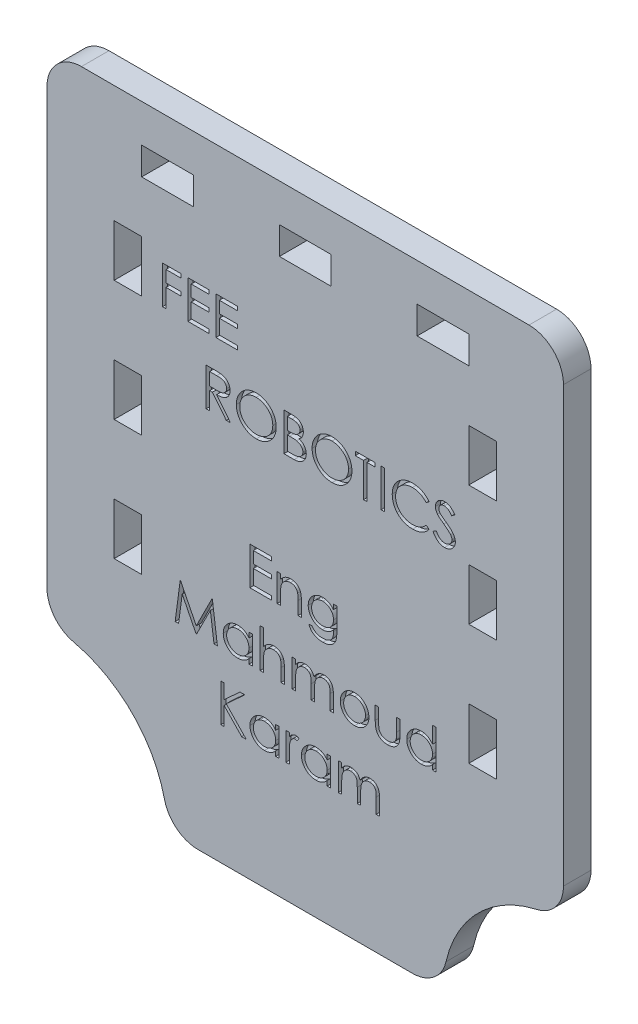
from build123d import *

# Parameters (mm, degrees)
BOSS_EXTRUDE1_DEPTH = 8
SKETCH2_W           = 0.987179487
SKETCH2_H           = 11
CUT_EXTRUDE1_DEPTH  = 1.5
SKETCH4_W           = 15
SKETCH4_H           = 8
CUT_EXTRUDE2_DEPTH  = 118.426572942
SKETCH5_W           = 8
SKETCH5_H           = 15
CUT_EXTRUDE3_DEPTH  = 118.426572942


with BuildPart() as part:
    # Sketch1 → Boss-Extrude1 (new body)
    with BuildSketch(Plane.XY):
        with BuildLine():
            Line((65, 90), (-65, 90))
            ThreePointArc((-65, 90), (-72.071067812, 87.071067812), (-75, 80))
            Line((-75, 80), (-75, -46.125178063))
            ThreePointArc((-75, -46.125178063), (-72.8173596, -52.361273708), (-67.222222222, -55.875138493))
            ThreePointArc((-67.222222222, -55.875138493), (-50.251262658, -65.251262658), (-40.875138493, -82.222222222))
            ThreePointArc((-40.875138493, -82.222222222), (-37.361273708, -87.8173596), (-31.125178063, -90))
            Line((-31.125178063, -90), (31.125178063, -90))
            ThreePointArc((31.125178063, -90), (37.361273708, -87.8173596), (40.875138493, -82.222222222))
            ThreePointArc((40.875138493, -82.222222222), (50.251262658, -65.251262658), (67.222222222, -55.875138493))
            ThreePointArc((67.222222222, -55.875138493), (72.8173596, -52.361273708), (75, -46.125178063))
            Line((75, -46.125178063), (75, 80))
            ThreePointArc((75, 80), (72.071067812, 87.071067812), (65, 90))
        make_face()
    extrude(amount=BOSS_EXTRUDE1_DEPTH)

    # Sketch2 → Cut-Extrude1 (cut)
    # profile 1 of 26: a face of its own
    with BuildSketch(Plane.XY.offset(8)):
        Polygon((-41.441284645, 52.378519332), (-36.082310286, 52.378519332), (-36.082310286, 51.250314204), (-40.454105158, 51.250314204), (-40.454105158, 47.865698819), (-36.082310286, 47.865698819), (-36.082310286, 46.737493691), (-40.454105158, 46.737493691), (-40.454105158, 41.378519332), (-41.441284645, 41.378519332), align=None)
    # profile 2 of 26: a face of its own
    with BuildSketch(Plane.XY.offset(8)):
        Polygon((-34.107951312, 52.378519332), (-27.902823107, 52.378519332), (-27.902823107, 51.250314204), (-33.120771825, 51.250314204), (-33.120771825, 47.865698819), (-27.902823107, 47.865698819), (-27.902823107, 46.737493691), (-33.120771825, 46.737493691), (-33.120771825, 42.50672446), (-27.902823107, 42.50672446), (-27.902823107, 41.378519332), (-34.107951312, 41.378519332), align=None)
    # profile 3 of 26: a face of its own
    with BuildSketch(Plane.XY.offset(8)):
        Polygon((-25.928464133, 52.378519332), (-19.723335927, 52.378519332), (-19.723335927, 51.250314204), (-24.941284645, 51.250314204), (-24.941284645, 47.865698819), (-19.723335927, 47.865698819), (-19.723335927, 46.737493691), (-24.941284645, 46.737493691), (-24.941284645, 42.50672446), (-19.723335927, 42.50672446), (-19.723335927, 41.378519332), (-25.928464133, 41.378519332), align=None)
    # profile 4 of 26: a face of its own
    with BuildSketch(Plane.XY.offset(8)):
        with BuildLine():
            Line((-28.748976953, 33.045185998), (-26.547654838, 33.045185998))
            add(Edge.make_bspline(
                [(-26.547654838, 33.045185998), (-26.400754148, 33.044697014), (-26.118688551, 33.043758109), (-25.71460113, 33.038522855), (-25.347430254, 33.023517737), (-25.017367902, 33.010605046), (-24.724420129, 32.987058944), (-24.467688644, 32.964554054), (-24.24835588, 32.935093977), (-24.115583205, 32.907734076), (-24.055467338, 32.895346255)],
                knots=[0, 0, 0, 0, 1.410062039, 2.707475311, 3.878576406, 4.937260626, 5.877586885, 6.699081471, 7.410979367, 8, 8, 8, 8], degree=3))
            add(Edge.make_bspline(
                [(-24.055467338, 32.895346255), (-23.974989376, 32.875462135), (-23.815750266, 32.836118078), (-23.58647863, 32.752959333), (-23.368005041, 32.656726227), (-23.161237021, 32.543697391), (-22.967210249, 32.413033798), (-22.783924129, 32.266991128), (-22.610546959, 32.106368481), (-22.454090407, 31.927116122), (-22.306567673, 31.73905852), (-22.182146275, 31.535703856), (-22.074891625, 31.323053341), (-21.989498571, 31.098944313), (-21.920739226, 30.865550173), (-21.87225676, 30.620756812), (-21.843181598, 30.365679462), (-21.840221481, 30.191697463), (-21.838720543, 30.103479268)],
                knots=[0, 0, 0, 0, 1.027469482, 2.033020251, 3.019912614, 3.986113645, 4.951240523, 5.91722682, 6.890402269, 7.87763091, 8.8651537, 9.85103654, 10.82876324, 11.815024772, 12.821070561, 13.842952187, 14.906261191, 16, 16, 16, 16], degree=3))
            add(Edge.make_bspline(
                [(-21.838720543, 30.103479268), (-21.843337394, 29.956911796), (-21.852346066, 29.670920697), (-21.936339249, 29.255872213), (-22.073922597, 28.868705795), (-22.263510077, 28.509908933), (-22.504942715, 28.186475476), (-22.795106344, 27.902391188), (-23.134162837, 27.664665749), (-23.44979783, 27.499814077), (-23.728613886, 27.394236364), (-23.958147155, 27.319950665), (-24.208529084, 27.262555917), (-24.477360708, 27.21113836), (-24.765760768, 27.172318749), (-25.073038034, 27.143886595), (-25.399411654, 27.126116727), (-25.623620157, 27.123470426), (-25.738960927, 27.122109075)],
                knots=[0, 0, 0, 0, 1.260483769, 2.459530307, 3.627416485, 4.787058657, 5.939039949, 7.08810263, 8.267026773, 9.491475466, 10.141966685, 10.831826277, 11.566392101, 12.351337768, 13.187381173, 14.07005841, 15.007169909, 16, 16, 16, 16], degree=3))
            Line((-25.738960927, 27.122109075), (-21.697694902, 22.045185998))
            Line((-21.697694902, 22.045185998), (-22.918448107, 22.045185998))
            Line((-22.918448107, 22.045185998), (-26.959714133, 27.122109075))
            Line((-26.959714133, 27.122109075), (-27.761797466, 27.122109075))
            Line((-27.761797466, 27.122109075), (-27.761797466, 22.045185998))
            Line((-27.761797466, 22.045185998), (-28.748976953, 22.045185998))
            Line((-28.748976953, 22.045185998), (-28.748976953, 33.045185998))
        make_face()
        with BuildLine():
            Line((-27.761797466, 31.91698087), (-27.761797466, 28.250314204))
            Line((-27.761797466, 28.250314204), (-25.74777503, 28.234889524))
            add(Edge.make_bspline(
                [(-25.74777503, 28.234889524), (-25.653740622, 28.234847923), (-25.471475157, 28.234767289), (-25.207787353, 28.247319157), (-24.962267002, 28.261598157), (-24.735853209, 28.283438957), (-24.52844483, 28.311586611), (-24.340145531, 28.34679599), (-24.170647939, 28.387816759), (-23.972966819, 28.451307583), (-23.752223434, 28.551897926), (-23.512324561, 28.698246636), (-23.308031499, 28.882321011), (-23.135432503, 29.092809015), (-22.996740004, 29.324237226), (-22.898959262, 29.573831529), (-22.836911586, 29.835290837), (-22.829593301, 30.014993462), (-22.82590003, 30.105682793)],
                knots=[0, 0, 0, 0, 1.146690395, 2.22261258, 3.21895312, 4.145990853, 4.996080663, 5.770904154, 6.481378293, 7.121626537, 8.300444488, 9.431385265, 10.535395872, 11.636531494, 12.74115979, 13.810798291, 14.895190096, 16, 16, 16, 16], degree=3))
            add(Edge.make_bspline(
                [(-22.82590003, 30.105682793), (-22.829678125, 30.194143454), (-22.83716493, 30.369440204), (-22.898289631, 30.626073065), (-23.001656258, 30.868283479), (-23.14095472, 31.095086146), (-23.31066635, 31.300961316), (-23.50966519, 31.477109512), (-23.732510089, 31.622464972), (-23.940790998, 31.715350168), (-24.126955666, 31.772298278), (-24.288591741, 31.812373364), (-24.471227813, 31.844570267), (-24.675750683, 31.87036703), (-24.901287237, 31.892539711), (-25.148977855, 31.907473873), (-25.417179164, 31.916317446), (-25.60306952, 31.916754582), (-25.699297466, 31.91698087)],
                knots=[0, 0, 0, 0, 1.101028733, 2.181837193, 3.264309656, 4.369019818, 5.486613113, 6.575447106, 7.666700264, 8.788928104, 9.402425223, 10.0903467, 10.862060571, 11.710948788, 12.657782767, 13.684531032, 14.801375019, 16, 16, 16, 16], degree=3))
            Line((-25.699297466, 31.91698087), (-27.761797466, 31.91698087))
        make_face(mode=Mode.SUBTRACT)
    # profile 5 of 26: a face of its own
    with BuildSketch(Plane.XY.offset(8)):
        with BuildLine():
            add(Edge.make_bspline(
                [(-14.293848748, 33.327237281), (-14.090166129, 33.322078345), (-13.690116662, 33.311945771), (-13.102166983, 33.234382874), (-12.540868112, 33.100197363), (-12.001647676, 32.921485132), (-11.490955464, 32.683085635), (-11.004947516, 32.394932312), (-10.544780198, 32.054006299), (-10.116655856, 31.662943014), (-9.72487687, 31.237452159), (-9.379709799, 30.783378728), (-9.090434018, 30.303468206), (-8.852878687, 29.799162738), (-8.666511628, 29.271602839), (-8.53790892, 28.717975973), (-8.455760448, 28.141869233), (-8.446156576, 27.748927658), (-8.441284645, 27.54959305)],
                knots=[0, 0, 0, 0, 1.065120563, 2.091984664, 3.0946048, 4.079830382, 5.057816894, 6.036188127, 7.030412546, 8.04752943, 9.064399622, 10.05169764, 11.02544977, 11.989514704, 12.962713494, 13.945757189, 14.957906945, 16, 16, 16, 16], degree=3))
            add(Edge.make_bspline(
                [(-8.441284645, 27.54959305), (-8.446155862, 27.35172679), (-8.455757594, 26.961709468), (-8.538002323, 26.389258644), (-8.666988323, 25.838973598), (-8.851148017, 25.311772975), (-9.087570949, 24.807100632), (-9.378772916, 24.326284491), (-9.721788149, 23.869166924), (-10.112152538, 23.440755691), (-10.53769867, 23.047906497), (-10.994136652, 22.705590031), (-11.471201372, 22.411028496), (-11.975031883, 22.175994092), (-12.498946284, 21.988139485), (-13.047633586, 21.860059791), (-13.618522755, 21.777443369), (-14.007831624, 21.767956605), (-14.205707722, 21.763134716)],
                knots=[0, 0, 0, 0, 1.043624062, 2.057103931, 3.04512605, 4.022047818, 4.998200453, 5.980619268, 6.982898556, 8.009068085, 9.034988726, 10.034168286, 11.015286542, 11.987931943, 12.962482838, 13.94673481, 14.956375938, 16, 16, 16, 16], degree=3))
            add(Edge.make_bspline(
                [(-14.205707722, 21.763134716), (-14.405041296, 21.768004218), (-14.797980832, 21.777603302), (-15.374811515, 21.859887717), (-15.928827281, 21.988560386), (-16.458443813, 22.172447185), (-16.963956449, 22.410101339), (-17.446353852, 22.699886531), (-17.903699743, 23.043737546), (-18.332202375, 23.433975351), (-18.724271284, 23.858800229), (-19.066086464, 24.313993602), (-19.355936821, 24.790625038), (-19.592793008, 25.290017256), (-19.780309881, 25.809756076), (-19.908239309, 26.353308434), (-19.991009444, 26.917575452), (-20.000547533, 27.301767418), (-20.005387209, 27.496708434)],
                knots=[0, 0, 0, 0, 1.053102029, 2.075944431, 3.073151272, 4.055350789, 5.033113405, 6.020478099, 7.024410459, 8.052272461, 9.079885166, 10.07527673, 11.055994387, 12.023226415, 12.992069828, 13.970394897, 14.97016774, 16, 16, 16, 16], degree=3))
            add(Edge.make_bspline(
                [(-20.005387209, 27.496708434), (-20.003706926, 27.627553966), (-20.000367558, 27.887594354), (-19.960165096, 28.273746526), (-19.901828321, 28.653688593), (-19.81822231, 29.026340144), (-19.708877071, 29.390788953), (-19.579856413, 29.749548493), (-19.422274042, 30.098983054), (-19.244134863, 30.440747999), (-19.045312037, 30.769515703), (-18.825702539, 31.080280107), (-18.593019952, 31.375648954), (-18.337935001, 31.647968109), (-18.068854745, 31.905159601), (-17.781414128, 32.143270997), (-17.477367074, 32.364449415), (-17.155405309, 32.563770486), (-16.823462159, 32.744042052), (-16.481278001, 32.898739298), (-16.133500204, 33.031512635), (-15.778499882, 33.139126657), (-15.417219742, 33.224084484), (-15.048871276, 33.281936167), (-14.673747936, 33.322241166), (-14.421026648, 33.325564744), (-14.293848748, 33.327237281)],
                knots=[0, 0, 0, 0, 1.037015668, 2.060948919, 3.074880161, 4.083647147, 5.086022904, 6.090072063, 7.104153813, 8.122640571, 9.144368836, 10.147691507, 11.138137339, 12.123020368, 13.103399296, 14.087645067, 15.080126199, 16.082011238, 17.087798457, 18.072939717, 19.057185487, 20.037253025, 21.01195951, 21.997135196, 22.992090687, 24, 24, 24, 24], degree=3))
        make_face()
        with BuildLine():
            add(Edge.make_bspline(
                [(-14.245371184, 32.199032152), (-14.349760032, 32.19775964), (-14.557539764, 32.195226781), (-14.866434021, 32.161863103), (-15.171265813, 32.114312024), (-15.472098094, 32.046484387), (-15.767672146, 31.95407165), (-16.060743076, 31.84771451), (-16.348638388, 31.718162511), (-16.630407656, 31.571791154), (-16.90356932, 31.40978026), (-17.161323525, 31.230726135), (-17.404337549, 31.038827822), (-17.632016387, 30.833637476), (-17.843691499, 30.614110156), (-18.043529132, 30.383573928), (-18.223519246, 30.135439413), (-18.388473916, 29.876435278), (-18.536087129, 29.60689888), (-18.667349672, 29.329667884), (-18.774722271, 29.042480868), (-18.862289739, 28.748453516), (-18.934889145, 28.4480515), (-18.980881478, 28.138995975), (-19.01461175, 27.822839908), (-19.016999836, 27.609182653), (-19.018207722, 27.501115486)],
                knots=[0, 0, 0, 0, 1.008559885, 2.007477868, 2.99961109, 3.989939068, 4.984837346, 5.991145699, 7.001802488, 8.033829008, 9.059044045, 10.069351652, 11.065060232, 12.050310815, 13.029377138, 14.011219647, 14.996725999, 15.989392538, 16.977580475, 17.965360261, 18.951710183, 19.937753436, 20.929683414, 21.935841486, 22.955955122, 24, 24, 24, 24], degree=3))
            add(Edge.make_bspline(
                [(-19.018207722, 27.501115486), (-19.014201013, 27.342205649), (-19.006318577, 27.029580839), (-18.937309071, 26.571452387), (-18.831011437, 26.131174916), (-18.674316857, 25.711157487), (-18.478357782, 25.307789741), (-18.23627327, 24.924649983), (-17.949459001, 24.561634664), (-17.623659346, 24.221278104), (-17.267502268, 23.910619862), (-16.889313688, 23.637934864), (-16.493145208, 23.407216935), (-16.077963713, 23.219258137), (-15.645985734, 23.070318961), (-15.194427716, 22.968243263), (-14.7262977, 22.90106326), (-14.407201355, 22.894611742), (-14.245371184, 22.891339845)],
                knots=[0, 0, 0, 0, 1.032063989, 2.030389145, 3.003944642, 3.970395727, 4.937377036, 5.913328081, 6.909231446, 7.93887556, 8.970685674, 9.976071282, 10.964166581, 11.944589148, 12.933237628, 13.927779006, 14.949070134, 16, 16, 16, 16], degree=3))
            add(Edge.make_bspline(
                [(-14.245371184, 22.891339845), (-14.136598464, 22.892834287), (-13.920869493, 22.895798215), (-13.599997851, 22.925651199), (-13.2849069, 22.973522789), (-12.976038592, 23.042447706), (-12.67374347, 23.128710355), (-12.376759804, 23.231191786), (-12.088250891, 23.359046997), (-11.804577115, 23.500311988), (-11.53304607, 23.661352483), (-11.273837254, 23.834329525), (-11.033484175, 24.02594519), (-10.805975664, 24.228086887), (-10.593431499, 24.444830409), (-10.397288977, 24.675893963), (-10.218208562, 24.922736029), (-10.05331653, 25.181347304), (-9.906220561, 25.451621241), (-9.778057678, 25.729857371), (-9.669327028, 26.015370572), (-9.581551728, 26.308572654), (-9.512768848, 26.60890675), (-9.465374814, 26.916774996), (-9.432222578, 27.231561501), (-9.429723764, 27.444470762), (-9.428464133, 27.551796575)],
                knots=[0, 0, 0, 0, 1.047197238, 2.076906641, 3.100256066, 4.114471768, 5.12198147, 6.126382909, 7.136867548, 8.15857795, 9.17633901, 10.174870724, 11.156907918, 12.133735059, 13.104061851, 14.077631395, 15.04955518, 16.038496417, 17.029181396, 18.010275684, 18.986308667, 19.968651475, 20.955262928, 21.950658345, 22.966943676, 24, 24, 24, 24], degree=3))
            add(Edge.make_bspline(
                [(-9.428464133, 27.551796575), (-9.429724773, 27.65838816), (-9.432225487, 27.869832204), (-9.465358978, 28.182423347), (-9.512818919, 28.488076297), (-9.581216002, 28.785591107), (-9.669373628, 29.075043614), (-9.778076666, 29.356161964), (-9.906259036, 29.629993434), (-10.053370598, 29.895861225), (-10.218734615, 30.15098183), (-10.399430808, 30.394875127), (-10.598579045, 30.622960885), (-10.810489409, 30.840869923), (-11.040455049, 31.043954719), (-11.287434259, 31.232282641), (-11.548428674, 31.410398646), (-11.824771414, 31.571078983), (-12.109966698, 31.719466572), (-12.402610565, 31.846598296), (-12.699387736, 31.954624957), (-12.999543517, 32.04676399), (-13.305604306, 32.114046371), (-13.615502054, 32.161905956), (-13.92880801, 32.195215169), (-14.139515272, 32.197755787), (-14.245371184, 32.199032152)],
                knots=[0, 0, 0, 0, 1.02996197, 2.043119294, 3.035359645, 4.018872909, 4.991431989, 5.957985074, 6.929999688, 7.912076566, 8.892894881, 9.867085534, 10.843653904, 11.817741046, 12.803660682, 13.806313499, 14.818574707, 15.856120519, 16.894564902, 17.924820532, 18.937903209, 19.946497019, 20.957711757, 21.963978472, 22.977135795, 24, 24, 24, 24], degree=3))
        make_face(mode=Mode.SUBTRACT)
    # profile 6 of 26: a face of its own
    with BuildSketch(Plane.XY.offset(8)):
        with BuildLine():
            Line((-6.184874389, 33.045185998), (-4.038640415, 33.045185998))
            add(Edge.make_bspline(
                [(-4.038640415, 33.045185998), (-3.933579483, 33.04463364), (-3.729945251, 33.043563032), (-3.433827005, 33.026958906), (-3.1564736, 33.0043188), (-2.897804601, 32.968395652), (-2.657939537, 32.925050067), (-2.436155534, 32.872558645), (-2.23315785, 32.809617859), (-1.990803535, 32.709529546), (-1.714481458, 32.560799589), (-1.41528651, 32.341024098), (-1.159444614, 32.072207786), (-0.938859046, 31.768976583), (-0.763484099, 31.435407014), (-0.636609164, 31.079449564), (-0.556284413, 30.705695518), (-0.54802362, 30.449102673), (-0.543848748, 30.319424781)],
                knots=[0, 0, 0, 0, 1.001505555, 1.941167018, 2.826882275, 3.653841531, 4.429895133, 5.150066043, 5.825578002, 6.45369114, 7.647487171, 8.808567382, 9.977351308, 11.170798116, 12.373658725, 13.556498008, 14.765093433, 16, 16, 16, 16], degree=3))
            add(Edge.make_bspline(
                [(-0.543848748, 30.319424781), (-0.547284577, 30.19794532), (-0.554036306, 29.959226723), (-0.618599264, 29.610073809), (-0.71967565, 29.277712835), (-0.860177862, 28.963356767), (-1.042784136, 28.674108268), (-1.259195995, 28.407634004), (-1.520294517, 28.175216396), (-1.715916128, 28.045281559), (-1.815283043, 27.97928055)],
                knots=[0, 0, 0, 0, 1.044552857, 2.05264487, 3.044412934, 4.028983338, 5.005914585, 5.980388656, 6.974128949, 8, 8, 8, 8], degree=3))
            add(Edge.make_bspline(
                [(-1.815283043, 27.97928055), (-1.690321699, 27.931304839), (-1.451239693, 27.839515419), (-1.122226511, 27.677232532), (-0.838756998, 27.500723043), (-0.598651682, 27.307965799), (-0.393304767, 27.100195251), (-0.213995522, 26.874364892), (-0.060996917, 26.627528796), (0.070100843, 26.362260542), (0.172396933, 26.081268784), (0.249006918, 25.787189202), (0.292904615, 25.481076314), (0.299151488, 25.272750836), (0.302305098, 25.167581832)],
                knots=[0, 0, 0, 0, 1.27268992, 2.434971085, 3.483601985, 4.442670788, 5.356604649, 6.2567628, 7.179492994, 8.113709626, 9.066344395, 10.018646069, 10.999752585, 12, 12, 12, 12], degree=3))
            add(Edge.make_bspline(
                [(0.302305098, 25.167581832), (0.299235011, 25.060200234), (0.293194528, 24.848923931), (0.248628902, 24.538550651), (0.173171709, 24.241943676), (0.06923382, 23.95718453), (-0.066419169, 23.684824108), (-0.231507057, 23.42455385), (-0.428349114, 23.17898881), (-0.648546702, 22.945400281), (-0.897656302, 22.735370092), (-1.166420103, 22.548320728), (-1.458222823, 22.394490247), (-1.768271947, 22.265268465), (-2.100045512, 22.166560127), (-2.452053706, 22.097503466), (-2.823992941, 22.05097335), (-3.079223587, 22.047147849), (-3.210114774, 22.045185998)],
                knots=[0, 0, 0, 0, 0.978564426, 1.925352924, 2.850884081, 3.763762016, 4.682927383, 5.618979971, 6.567305752, 7.547517671, 8.540179244, 9.531824382, 10.526200242, 11.540722885, 12.589160233, 13.674978461, 14.80764778, 16, 16, 16, 16], degree=3))
            Line((-3.210114774, 22.045185998), (-6.184874389, 22.045185998))
            Line((-6.184874389, 22.045185998), (-6.184874389, 33.045185998))
        make_face()
        with BuildLine():
            Line((-5.197694902, 31.91698087), (-5.197694902, 28.391339845))
            Line((-5.197694902, 28.391339845), (-4.534433684, 28.391339845))
            add(Edge.make_bspline(
                [(-4.534433684, 28.391339845), (-4.437480327, 28.392596746), (-4.250146684, 28.395025334), (-3.97885558, 28.401982102), (-3.727034094, 28.421461667), (-3.495116905, 28.440935634), (-3.283469224, 28.472598623), (-3.092559945, 28.510288152), (-2.919392926, 28.550148711), (-2.719697211, 28.617938527), (-2.49318223, 28.718125506), (-2.25170676, 28.87360842), (-2.038826999, 29.058799244), (-1.859064409, 29.272485124), (-1.711942644, 29.507778851), (-1.609756682, 29.76092619), (-1.540465218, 30.025618033), (-1.534206119, 30.207332542), (-1.531028235, 30.29959305)],
                knots=[0, 0, 0, 0, 1.156816544, 2.235205308, 3.236616184, 4.169592532, 5.011045266, 5.787822928, 6.49130361, 7.128639758, 8.301311294, 9.436451833, 10.541879658, 11.654887649, 12.756523258, 13.837046038, 14.901820046, 16, 16, 16, 16], degree=3))
            add(Edge.make_bspline(
                [(-1.531028235, 30.29959305), (-1.532681944, 30.360645475), (-1.535925875, 30.480406473), (-1.562493398, 30.654990157), (-1.607648632, 30.819184808), (-1.665647839, 30.975240583), (-1.746698004, 31.118277827), (-1.842126031, 31.253242156), (-1.957423915, 31.375537386), (-2.088661183, 31.489841523), (-2.239545427, 31.591181468), (-2.409986629, 31.679938152), (-2.602290757, 31.751409164), (-2.813216873, 31.814002786), (-3.046011719, 31.857965996), (-3.297988887, 31.894590928), (-3.57121229, 31.913236689), (-3.760239755, 31.915704972), (-3.857951312, 31.91698087)],
                knots=[0, 0, 0, 0, 0.91205012, 1.789085906, 2.630437955, 3.453916878, 4.269457761, 5.079663411, 5.91843418, 6.774407191, 7.675494373, 8.627863946, 9.638891023, 10.736472738, 11.911756761, 13.175263542, 14.539845004, 16, 16, 16, 16], degree=3))
            Line((-3.857951312, 31.91698087), (-5.197694902, 31.91698087))
        make_face(mode=Mode.SUBTRACT)
        with BuildLine():
            Line((-5.197694902, 27.263134716), (-5.197694902, 23.173391127))
            Line((-5.197694902, 23.173391127), (-3.791845543, 23.173391127))
            add(Edge.make_bspline(
                [(-3.791845543, 23.173391127), (-3.691214633, 23.17459719), (-3.49726182, 23.176921718), (-3.217229383, 23.184510318), (-2.957682485, 23.201771756), (-2.719805487, 23.228944426), (-2.501029779, 23.258419552), (-2.303979855, 23.298055006), (-2.12705839, 23.343466025), (-1.921910565, 23.413659138), (-1.690899539, 23.522705189), (-1.441951134, 23.68712133), (-1.220611591, 23.882994583), (-1.032652205, 24.109691741), (-0.878611384, 24.356190198), (-0.766551382, 24.617504155), (-0.697437261, 24.889315812), (-0.689070443, 25.074639766), (-0.684874389, 25.167581832)],
                knots=[0, 0, 0, 0, 1.160039823, 2.235823828, 3.228722157, 4.157150951, 4.99529583, 5.772374946, 6.472645482, 7.099169577, 8.269452708, 9.405989375, 10.527446681, 11.663510218, 12.788923519, 13.866172445, 14.929861265, 16, 16, 16, 16], degree=3))
            add(Edge.make_bspline(
                [(-0.684874389, 25.167581832), (-0.685742145, 25.225703759), (-0.687463661, 25.341010102), (-0.713425594, 25.510459819), (-0.751183471, 25.674598278), (-0.799996548, 25.833871177), (-0.871086302, 25.985398931), (-0.954078301, 26.132178404), (-1.051385563, 26.274403625), (-1.203010084, 26.454213565), (-1.423550607, 26.661381319), (-1.736914759, 26.864213469), (-2.093227695, 27.027792292), (-2.351656958, 27.097247789), (-2.485154838, 27.133126704)],
                knots=[0, 0, 0, 0, 0.723448775, 1.435228256, 2.130040452, 2.821711965, 3.505591119, 4.210454504, 4.921174351, 5.648778258, 7.137944449, 8.670945889, 10.280296675, 12, 12, 12, 12], degree=3))
            add(Edge.make_bspline(
                [(-2.485154838, 27.133126704), (-2.538674853, 27.143985539), (-2.654717286, 27.167529734), (-2.84394111, 27.192382516), (-3.059968127, 27.214524133), (-3.30329717, 27.230902057), (-3.574236099, 27.247831193), (-3.873363558, 27.254414917), (-4.199457975, 27.262269734), (-4.425719717, 27.262839013), (-4.543247786, 27.263134716)],
                knots=[0, 0, 0, 0, 0.634451884, 1.375622551, 2.216452059, 3.157844607, 4.20941857, 5.370758133, 6.634282058, 8, 8, 8, 8], degree=3))
            Line((-4.543247786, 27.263134716), (-5.197694902, 27.263134716))
        make_face(mode=Mode.SUBTRACT)
    # profile 7 of 26: a face of its own
    with BuildSketch(Plane.XY.offset(8)):
        with BuildLine():
            add(Edge.make_bspline(
                [(7.706151252, 33.327237281), (7.909833871, 33.322078345), (8.309883338, 33.311945771), (8.897833017, 33.234382874), (9.459131888, 33.100197363), (9.998352324, 32.921485132), (10.509044536, 32.683085635), (10.995052484, 32.394932312), (11.455219802, 32.054006299), (11.883344144, 31.662943014), (12.27512313, 31.237452159), (12.620290201, 30.783378728), (12.909565982, 30.303468206), (13.147121313, 29.799162738), (13.333488372, 29.271602839), (13.46209108, 28.717975973), (13.544239552, 28.141869233), (13.553843424, 27.748927658), (13.558715355, 27.54959305)],
                knots=[0, 0, 0, 0, 1.065120563, 2.091984664, 3.0946048, 4.079830382, 5.057816894, 6.036188127, 7.030412546, 8.04752943, 9.064399622, 10.05169764, 11.02544977, 11.989514704, 12.962713494, 13.945757189, 14.957906945, 16, 16, 16, 16], degree=3))
            add(Edge.make_bspline(
                [(13.558715355, 27.54959305), (13.553844138, 27.35172679), (13.544242406, 26.961709468), (13.461997677, 26.389258644), (13.333011677, 25.838973598), (13.148851983, 25.311772975), (12.912429051, 24.807100632), (12.621227084, 24.326284491), (12.278211851, 23.869166924), (11.887847462, 23.440755691), (11.46230133, 23.047906497), (11.005863348, 22.705590031), (10.528798628, 22.411028496), (10.024968117, 22.175994092), (9.501053716, 21.988139485), (8.952366414, 21.860059791), (8.381477245, 21.777443369), (7.992168376, 21.767956605), (7.794292278, 21.763134716)],
                knots=[0, 0, 0, 0, 1.043624062, 2.057103931, 3.04512605, 4.022047818, 4.998200453, 5.980619268, 6.982898556, 8.009068085, 9.034988726, 10.034168286, 11.015286542, 11.987931943, 12.962482838, 13.94673481, 14.956375938, 16, 16, 16, 16], degree=3))
            add(Edge.make_bspline(
                [(7.794292278, 21.763134716), (7.594958704, 21.768004218), (7.202019168, 21.777603302), (6.625188485, 21.859887717), (6.071172719, 21.988560386), (5.541556187, 22.172447185), (5.036043551, 22.410101339), (4.553646148, 22.699886531), (4.096300257, 23.043737546), (3.667797625, 23.433975351), (3.275728716, 23.858800229), (2.933913536, 24.313993602), (2.644063179, 24.790625038), (2.407206992, 25.290017256), (2.219690119, 25.809756076), (2.091760691, 26.353308434), (2.008990556, 26.917575452), (1.999452467, 27.301767418), (1.994612791, 27.496708434)],
                knots=[0, 0, 0, 0, 1.053102029, 2.075944431, 3.073151272, 4.055350789, 5.033113405, 6.020478099, 7.024410459, 8.052272461, 9.079885166, 10.07527673, 11.055994387, 12.023226415, 12.992069828, 13.970394897, 14.97016774, 16, 16, 16, 16], degree=3))
            add(Edge.make_bspline(
                [(1.994612791, 27.496708434), (1.996293074, 27.627553966), (1.999632442, 27.887594354), (2.039834904, 28.273746526), (2.098171679, 28.653688593), (2.18177769, 29.026340144), (2.291122929, 29.390788953), (2.420143587, 29.749548493), (2.577725958, 30.098983054), (2.755865137, 30.440747999), (2.954687963, 30.769515703), (3.174297461, 31.080280107), (3.406980048, 31.375648954), (3.662064999, 31.647968109), (3.931145255, 31.905159601), (4.218585872, 32.143270997), (4.522632926, 32.364449415), (4.844594691, 32.563770486), (5.176537841, 32.744042052), (5.518721999, 32.898739298), (5.866499796, 33.031512635), (6.221500118, 33.139126657), (6.582780258, 33.224084484), (6.951128724, 33.281936167), (7.326252064, 33.322241166), (7.578973352, 33.325564744), (7.706151252, 33.327237281)],
                knots=[0, 0, 0, 0, 1.037015668, 2.060948919, 3.074880161, 4.083647147, 5.086022904, 6.090072063, 7.104153813, 8.122640571, 9.144368836, 10.147691507, 11.138137339, 12.123020368, 13.103399296, 14.087645067, 15.080126199, 16.082011238, 17.087798457, 18.072939717, 19.057185487, 20.037253025, 21.01195951, 21.997135196, 22.992090687, 24, 24, 24, 24], degree=3))
        make_face()
        with BuildLine():
            add(Edge.make_bspline(
                [(7.754628816, 32.199032152), (7.650239968, 32.19775964), (7.442460236, 32.195226781), (7.133565979, 32.161863103), (6.828734187, 32.114312024), (6.527901906, 32.046484387), (6.232327854, 31.95407165), (5.939256924, 31.84771451), (5.651361612, 31.718162511), (5.369592344, 31.571791154), (5.09643068, 31.40978026), (4.838676475, 31.230726135), (4.595662451, 31.038827822), (4.367983613, 30.833637476), (4.156308501, 30.614110156), (3.956470868, 30.383573928), (3.776480754, 30.135439413), (3.611526084, 29.876435278), (3.463912871, 29.60689888), (3.332650328, 29.329667884), (3.225277729, 29.042480868), (3.137710261, 28.748453516), (3.065110855, 28.4480515), (3.019118522, 28.138995975), (2.98538825, 27.822839908), (2.983000164, 27.609182653), (2.981792278, 27.501115486)],
                knots=[0, 0, 0, 0, 1.008559885, 2.007477868, 2.99961109, 3.989939068, 4.984837346, 5.991145699, 7.001802488, 8.033829008, 9.059044045, 10.069351652, 11.065060232, 12.050310815, 13.029377138, 14.011219647, 14.996725999, 15.989392538, 16.977580475, 17.965360261, 18.951710183, 19.937753436, 20.929683414, 21.935841486, 22.955955122, 24, 24, 24, 24], degree=3))
            add(Edge.make_bspline(
                [(2.981792278, 27.501115486), (2.985798987, 27.342205649), (2.993681423, 27.029580839), (3.062690929, 26.571452387), (3.168988563, 26.131174916), (3.325683143, 25.711157487), (3.521642218, 25.307789741), (3.76372673, 24.924649983), (4.050540999, 24.561634664), (4.376340654, 24.221278104), (4.732497732, 23.910619862), (5.110686312, 23.637934864), (5.506854792, 23.407216935), (5.922036287, 23.219258137), (6.354014266, 23.070318961), (6.805572284, 22.968243263), (7.2737023, 22.90106326), (7.592798645, 22.894611742), (7.754628816, 22.891339845)],
                knots=[0, 0, 0, 0, 1.032063989, 2.030389145, 3.003944642, 3.970395727, 4.937377036, 5.913328081, 6.909231446, 7.93887556, 8.970685674, 9.976071282, 10.964166581, 11.944589148, 12.933237628, 13.927779006, 14.949070134, 16, 16, 16, 16], degree=3))
            add(Edge.make_bspline(
                [(7.754628816, 22.891339845), (7.863401536, 22.892834287), (8.079130507, 22.895798215), (8.400002149, 22.925651199), (8.7150931, 22.973522789), (9.023961408, 23.042447706), (9.32625653, 23.128710355), (9.623240196, 23.231191786), (9.911749109, 23.359046997), (10.195422885, 23.500311988), (10.46695393, 23.661352483), (10.726162746, 23.834329525), (10.966515825, 24.02594519), (11.194024336, 24.228086887), (11.406568501, 24.444830409), (11.602711023, 24.675893963), (11.781791438, 24.922736029), (11.94668347, 25.181347304), (12.093779439, 25.451621241), (12.221942322, 25.729857371), (12.330672972, 26.015370572), (12.418448272, 26.308572654), (12.487231152, 26.60890675), (12.534625186, 26.916774996), (12.567777422, 27.231561501), (12.570276236, 27.444470762), (12.571535867, 27.551796575)],
                knots=[0, 0, 0, 0, 1.047197238, 2.076906641, 3.100256066, 4.114471768, 5.12198147, 6.126382909, 7.136867548, 8.15857795, 9.17633901, 10.174870724, 11.156907918, 12.133735059, 13.104061851, 14.077631395, 15.04955518, 16.038496417, 17.029181396, 18.010275684, 18.986308667, 19.968651475, 20.955262928, 21.950658345, 22.966943676, 24, 24, 24, 24], degree=3))
            add(Edge.make_bspline(
                [(12.571535867, 27.551796575), (12.570275227, 27.65838816), (12.567774513, 27.869832204), (12.534641022, 28.182423347), (12.487181081, 28.488076297), (12.418783998, 28.785591107), (12.330626372, 29.075043614), (12.221923334, 29.356161964), (12.093740964, 29.629993434), (11.946629402, 29.895861225), (11.781265385, 30.15098183), (11.600569192, 30.394875127), (11.401420955, 30.622960885), (11.189510591, 30.840869923), (10.959544951, 31.043954719), (10.712565741, 31.232282641), (10.451571326, 31.410398646), (10.175228586, 31.571078983), (9.890033302, 31.719466572), (9.597389435, 31.846598296), (9.300612264, 31.954624957), (9.000456483, 32.04676399), (8.694395694, 32.114046371), (8.384497946, 32.161905956), (8.07119199, 32.195215169), (7.860484728, 32.197755787), (7.754628816, 32.199032152)],
                knots=[0, 0, 0, 0, 1.02996197, 2.043119294, 3.035359645, 4.018872909, 4.991431989, 5.957985074, 6.929999688, 7.912076566, 8.892894881, 9.867085534, 10.843653904, 11.817741046, 12.803660682, 13.806313499, 14.818574707, 15.856120519, 16.894564902, 17.924820532, 18.937903209, 19.946497019, 20.957711757, 21.963978472, 22.977135795, 24, 24, 24, 24], degree=3))
        make_face(mode=Mode.SUBTRACT)
    # profile 8 of 26: a face of its own
    with BuildSketch(Plane.XY.offset(8)):
        Polygon((14.545894842, 31.91698087), (14.545894842, 33.045185998), (20.327946124, 33.045185998), (20.327946124, 31.91698087), (17.930510226, 31.91698087), (17.930510226, 22.045185998), (16.943330739, 22.045185998), (16.943330739, 31.91698087), align=None)
    # profile 9 of 26: a face of its own
    with BuildSketch(Plane.XY.offset(8)):
        with Locations((22.51384356, 27.545185998)):
            Rectangle(SKETCH2_W, SKETCH2_H)
    # profile 10 of 26: a face of its own
    with BuildSketch(Plane.XY.offset(8)):
        with BuildLine():
            Line((35.981792278, 31.026756511), (35.118010226, 30.365698819))
            add(Edge.make_bspline(
                [(35.118010226, 30.365698819), (35.05639172, 30.439134724), (34.933985459, 30.585016459), (34.737056537, 30.789866456), (34.531822802, 30.981785849), (34.318362706, 31.1616889), (34.092834045, 31.323284449), (33.860700107, 31.47499363), (33.618077679, 31.610977949), (33.282572227, 31.77586162), (32.84367899, 31.947920964), (32.291180924, 32.092188262), (31.714431757, 32.184026243), (31.320953587, 32.193972888), (31.120814714, 32.199032152)],
                knots=[0, 0, 0, 0, 0.757959112, 1.505699292, 2.245454638, 2.979532153, 3.711538275, 4.438200793, 5.171680507, 5.909471876, 7.393775596, 8.890124382, 10.418191784, 12, 12, 12, 12], degree=3))
            add(Edge.make_bspline(
                [(31.120814714, 32.199032152), (31.010552916, 32.197762556), (30.791052653, 32.195235146), (30.465300308, 32.161892181), (30.145630719, 32.115028378), (29.832251825, 32.045491648), (29.525562527, 31.957577702), (29.223557834, 31.852526401), (28.930610235, 31.722554048), (28.642667201, 31.578899516), (28.36678968, 31.416641833), (28.10575953, 31.239657013), (27.860528774, 31.049925567), (27.630903422, 30.846736375), (27.416648727, 30.631004499), (27.219317179, 30.400430854), (27.039591603, 30.155752595), (26.873909525, 29.900196171), (26.725526648, 29.634505969), (26.601289885, 29.357698604), (26.491273786, 29.074514281), (26.404219024, 28.781753489), (26.335313399, 28.481476225), (26.287769315, 28.172876606), (26.254805548, 27.856599327), (26.252290706, 27.642227202), (26.251023047, 27.53416837)],
                knots=[0, 0, 0, 0, 1.054917814, 2.100044995, 3.131103042, 4.146048494, 5.169673617, 6.183595914, 7.203665975, 8.234915748, 9.262203917, 10.264457458, 11.251630812, 12.227803204, 13.197192746, 14.159520551, 15.12972552, 16.100847026, 17.073214652, 18.039054194, 19.002613845, 19.979014051, 20.95965708, 21.949030935, 22.966165397, 24, 24, 24, 24], degree=3))
            add(Edge.make_bspline(
                [(26.251023047, 27.53416837), (26.254988764, 27.371584222), (26.262774923, 27.052371812), (26.332069687, 26.584807036), (26.437371403, 26.136884919), (26.595191787, 25.711405414), (26.789794518, 25.303122003), (27.035693583, 24.91894275), (27.320488414, 24.553062119), (27.648208018, 24.21412714), (28.007769154, 23.904512575), (28.393548305, 23.63186789), (28.804584638, 23.404592545), (29.236339761, 23.215468142), (29.692136119, 23.070089855), (30.17115407, 22.967745467), (30.672351769, 22.900984328), (31.014827026, 22.894592737), (31.189124008, 22.891339845)],
                knots=[0, 0, 0, 0, 1.029171465, 2.020641659, 2.987623507, 3.938342917, 4.889210282, 5.84687017, 6.821220943, 7.821438502, 8.827599549, 9.822697543, 10.807740252, 11.797342354, 12.80366471, 13.83203677, 14.896651826, 16, 16, 16, 16], degree=3))
            add(Edge.make_bspline(
                [(31.189124008, 22.891339845), (31.381161031, 22.896647438), (31.759135831, 22.907094052), (32.313435342, 22.995594549), (32.844062034, 23.139090862), (33.351044449, 23.339912904), (33.832953337, 23.600975237), (34.290542841, 23.917454281), (34.724199205, 24.292360469), (34.984966092, 24.578621729), (35.118010226, 24.724673178)],
                knots=[0, 0, 0, 0, 1.028121516, 2.023589091, 2.998037872, 3.967518031, 4.937445131, 5.927275754, 6.942489185, 8, 8, 8, 8], degree=3))
            Line((35.118010226, 24.724673178), (35.981792278, 24.070226063))
            add(Edge.make_bspline(
                [(35.981792278, 24.070226063), (35.912278218, 23.980533785), (35.773583067, 23.801578851), (35.549000728, 23.549296335), (35.312414936, 23.311997938), (35.062068419, 23.091596842), (34.800841074, 22.883682808), (34.524042378, 22.694162766), (34.235311133, 22.520391416), (33.935625628, 22.361278224), (33.625304274, 22.220109734), (33.304718907, 22.099255035), (32.975251384, 21.995148239), (32.636886643, 21.909499295), (32.288922836, 21.842647317), (31.932615631, 21.797956911), (31.567196024, 21.767339465), (31.320665843, 21.764548873), (31.195734585, 21.763134716)],
                knots=[0, 0, 0, 0, 0.986787822, 1.968848986, 2.935600012, 3.899624008, 4.868462664, 5.837806735, 6.815139263, 7.798259679, 8.787526145, 9.778297419, 10.776456485, 11.791383307, 12.812564526, 13.85620153, 14.913611965, 16, 16, 16, 16], degree=3))
            add(Edge.make_bspline(
                [(31.195734585, 21.763134716), (31.077425918, 21.763958122), (30.843485177, 21.765586303), (30.498089101, 21.791961687), (30.161836132, 21.827946574), (29.835687308, 21.882129843), (29.517862815, 21.946069198), (29.211243836, 22.031778861), (28.912813174, 22.127790528), (28.623769818, 22.240634772), (28.343867904, 22.367971345), (28.074010211, 22.511887673), (27.814320852, 22.671173534), (27.562246673, 22.842317852), (27.32151141, 23.030817944), (27.090028901, 23.234055938), (26.866501119, 23.451346829), (26.728206966, 23.608033511), (26.658675291, 23.686812601)],
                knots=[0, 0, 0, 0, 1.114604814, 2.203992996, 3.262667896, 4.300477797, 5.318619304, 6.316056647, 7.298880507, 8.271930387, 9.238335007, 10.195173496, 11.151986948, 12.108099108, 13.064862484, 14.031167946, 15.010108607, 16, 16, 16, 16], degree=3))
            add(Edge.make_bspline(
                [(26.658675291, 23.686812601), (26.547306125, 23.823656338), (26.325912341, 24.095691713), (26.042660193, 24.536590511), (25.800196448, 24.996919168), (25.60415784, 25.479096087), (25.450903535, 25.982039304), (25.344734065, 26.506002349), (25.275743308, 27.050495882), (25.267853829, 27.420840075), (25.26384356, 27.609088242)],
                knots=[0, 0, 0, 0, 0.994628077, 1.977248131, 2.950237994, 3.925870899, 4.908910175, 5.911660606, 6.938484602, 8, 8, 8, 8], degree=3))
            add(Edge.make_bspline(
                [(25.26384356, 27.609088242), (25.268731311, 27.806948239), (25.278347656, 28.19622543), (25.360048728, 28.767514998), (25.49147923, 29.314847966), (25.678155166, 29.837202592), (25.914829127, 30.337326329), (26.207198485, 30.811398688), (26.551866646, 31.262451486), (26.94613043, 31.683640705), (27.378484912, 32.068764384), (27.841486899, 32.407583882), (28.334230161, 32.689553218), (28.851286266, 32.925255443), (29.39652698, 33.106423755), (29.968788997, 33.233248056), (30.566997015, 33.312187565), (30.975136067, 33.32216679), (31.182513432, 33.327237281)],
                knots=[0, 0, 0, 0, 1.032925535, 2.032216505, 3.007276963, 3.968222605, 4.92396291, 5.891752235, 6.871517503, 7.883894988, 8.900124299, 9.891468569, 10.874487609, 11.85992873, 12.854644235, 13.869047385, 14.917252991, 16, 16, 16, 16], degree=3))
            add(Edge.make_bspline(
                [(31.182513432, 33.327237281), (31.308901772, 33.325721989), (31.559074763, 33.322722622), (31.929154528, 33.293474747), (32.289458984, 33.244717699), (32.640236356, 33.178352908), (32.98319315, 33.095987041), (33.315708193, 32.98868896), (33.639732637, 32.866002719), (33.95322292, 32.724704683), (34.254674935, 32.566094924), (34.543994793, 32.391931536), (34.818884349, 32.202430433), (35.081277873, 31.99920331), (35.326785965, 31.777950695), (35.562379183, 31.544758251), (35.780056857, 31.292909089), (35.914424041, 31.11563644), (35.981792278, 31.026756511)],
                knots=[0, 0, 0, 0, 1.096760587, 2.17092713, 3.219439832, 4.250915756, 5.268269357, 6.278326846, 7.281116186, 8.274029601, 9.260640565, 10.235837813, 11.203064059, 12.156899882, 13.114053108, 14.069676657, 15.032185724, 16, 16, 16, 16], degree=3))
        make_face()
    # profile 11 of 26: a face of its own
    with BuildSketch(Plane.XY.offset(8)):
        with BuildLine():
            Line((37.109997406, 24.167181191), (38.039885226, 24.724673178))
            add(Edge.make_bspline(
                [(38.039885226, 24.724673178), (38.126371115, 24.579899397), (38.29207474, 24.302518419), (38.568493297, 23.927707435), (38.854911018, 23.609140656), (39.153448923, 23.348671318), (39.46228476, 23.143603388), (39.783434643, 22.998396374), (40.115816334, 22.90783188), (40.342019773, 22.896831608), (40.454949329, 22.891339845)],
                knots=[0, 0, 0, 0, 1.272034388, 2.437168799, 3.508375237, 4.49857839, 5.41946034, 6.295179144, 7.148887113, 8, 8, 8, 8], degree=3))
            add(Edge.make_bspline(
                [(40.454949329, 22.891339845), (40.551393748, 22.894025958), (40.742595034, 22.899351185), (41.02407637, 22.95051942), (41.297447748, 23.029128968), (41.557074895, 23.141709038), (41.799375398, 23.277915708), (42.011853583, 23.442432266), (42.195541368, 23.626623198), (42.345798585, 23.832111541), (42.461078696, 24.053108294), (42.549682339, 24.279946998), (42.598852571, 24.51619107), (42.60625951, 24.675252524), (42.609997406, 24.755522537)],
                knots=[0, 0, 0, 0, 1.095163259, 2.171163733, 3.241058638, 4.321873601, 5.38011039, 6.391990106, 7.366004449, 8.327778327, 9.272591725, 10.192022065, 11.087607919, 12, 12, 12, 12], degree=3))
            add(Edge.make_bspline(
                [(42.609997406, 24.755522537), (42.605363858, 24.847108065), (42.595944532, 25.033288059), (42.516331309, 25.307972683), (42.391090819, 25.579806474), (42.275551082, 25.747953309), (42.215566316, 25.835250101)],
                knots=[0, 0, 0, 0, 0.938893495, 1.908633276, 2.914225137, 4, 4, 4, 4], degree=3))
            add(Edge.make_bspline(
                [(42.215566316, 25.835250101), (42.166315814, 25.898254404), (42.062920547, 26.030524056), (41.885168364, 26.227409082), (41.676589148, 26.430495542), (41.444320832, 26.647538292), (41.179902553, 26.868442796), (40.891616079, 27.103743098), (40.572101094, 27.344490912), (40.348016962, 27.505947546), (40.232393239, 27.589256511)],
                knots=[0, 0, 0, 0, 0.722233717, 1.516239348, 2.393582979, 3.351407094, 4.387010283, 5.505090956, 6.712668013, 8, 8, 8, 8], degree=3))
            add(Edge.make_bspline(
                [(40.232393239, 27.589256511), (40.11666068, 27.671689215), (39.895388839, 27.829294268), (39.58594758, 28.063199161), (39.309236411, 28.277051322), (39.066485216, 28.472863932), (38.857800769, 28.650663546), (38.68153862, 28.808742784), (38.542188869, 28.951376832), (38.464699901, 29.043906763), (38.429909265, 29.085450422)],
                knots=[0, 0, 0, 0, 1.452282411, 2.77665338, 3.964542531, 5.026858415, 5.96415736, 6.766646006, 7.446254459, 8, 8, 8, 8], degree=3))
            add(Edge.make_bspline(
                [(38.429909265, 29.085450422), (38.381281266, 29.150196537), (38.285647779, 29.277528464), (38.159411762, 29.476549445), (38.05211725, 29.680279708), (37.968007063, 29.889266711), (37.897178947, 30.100576487), (37.849539736, 30.316966117), (37.819709631, 30.537464632), (37.816654817, 30.685849919), (37.815125611, 30.760129909)],
                knots=[0, 0, 0, 0, 1.068054152, 2.10047183, 3.106115577, 4.101338837, 5.06977816, 6.043150881, 7.020423561, 8, 8, 8, 8], degree=3))
            add(Edge.make_bspline(
                [(37.815125611, 30.760129909), (37.819227696, 30.8765092), (37.827344188, 31.106780258), (37.895985814, 31.443162868), (38.004329194, 31.764320179), (38.156113127, 32.067072656), (38.351779093, 32.343537168), (38.578209299, 32.596893841), (38.847902541, 32.809880814), (39.143810786, 32.995975854), (39.467702241, 33.141634476), (39.807102223, 33.251511843), (40.162550163, 33.31376951), (40.403302872, 33.322703914), (40.52546215, 33.327237281)],
                knots=[0, 0, 0, 0, 1.005424448, 1.989358655, 2.955360095, 3.929531133, 4.905563448, 5.876582895, 6.856512386, 7.866279853, 8.892233794, 9.918561126, 10.94386622, 12, 12, 12, 12], degree=3))
            add(Edge.make_bspline(
                [(40.52546215, 33.327237281), (40.655086465, 33.322766404), (40.912867856, 33.313875258), (41.292051105, 33.236568731), (41.657127642, 33.108652334), (41.950806474, 32.96348798), (42.180652296, 32.818503531), (42.355938027, 32.686441226), (42.533564301, 32.53440517), (42.714963902, 32.361990397), (42.897063118, 32.167614893), (43.082565396, 31.952609871), (43.271904527, 31.718289267), (43.393708658, 31.551012265), (43.456151252, 31.465258114)],
                knots=[0, 0, 0, 0, 1.286793592, 2.559021753, 3.825965368, 5.121522368, 5.803751409, 6.523245864, 7.299691795, 8.125521123, 9.008227632, 9.944561021, 10.946284179, 12, 12, 12, 12], degree=3))
            Line((43.456151252, 31.465258114), (42.563723367, 30.788775742))
            add(Edge.make_bspline(
                [(42.563723367, 30.788775742), (42.509836151, 30.858197341), (42.406061972, 30.991887108), (42.248512156, 31.179111243), (42.100016405, 31.350134464), (41.953715149, 31.498682009), (41.817335164, 31.632888714), (41.684967317, 31.747790807), (41.558516499, 31.844514107), (41.399120494, 31.947736724), (41.198864808, 32.050057164), (40.947484837, 32.13663998), (40.684785115, 32.188670175), (40.505863416, 32.195549536), (40.415285867, 32.199032152)],
                knots=[0, 0, 0, 0, 1.181633172, 2.275549214, 3.290209073, 4.226197932, 5.078386478, 5.862611352, 6.581680152, 7.217281963, 8.414376989, 9.595101626, 10.782541182, 12, 12, 12, 12], degree=3))
            add(Edge.make_bspline(
                [(40.415285867, 32.199032152), (40.301651083, 32.195223952), (40.082517105, 32.187880198), (39.771404935, 32.10767453), (39.491395456, 31.981388683), (39.25080168, 31.804398752), (39.050485466, 31.594704203), (38.905582596, 31.35339923), (38.818367793, 31.086940251), (38.8077252, 30.901066474), (38.802305098, 30.806403947)],
                knots=[0, 0, 0, 0, 1.14458467, 2.207223713, 3.21896685, 4.227309161, 5.202851033, 6.127160689, 7.046193047, 8, 8, 8, 8], degree=3))
            add(Edge.make_bspline(
                [(38.802305098, 30.806403947), (38.803540639, 30.747470729), (38.806013741, 30.629507925), (38.840505962, 30.455232027), (38.884818139, 30.281396389), (38.955037839, 30.108782557), (39.051980222, 29.934371715), (39.179282203, 29.75516054), (39.339609755, 29.569569455), (39.462423223, 29.448860566), (39.527265034, 29.385129909)],
                knots=[0, 0, 0, 0, 0.858281714, 1.717966888, 2.583508476, 3.4729293, 4.427298488, 5.488583878, 6.674047936, 8, 8, 8, 8], degree=3))
            add(Edge.make_bspline(
                [(39.527265034, 29.385129909), (39.551343633, 29.363642113), (39.608548873, 29.31259203), (39.713130354, 29.229016291), (39.851236291, 29.125921864), (40.019260352, 28.998361726), (40.220300631, 28.850391417), (40.454379236, 28.683902921), (40.718886911, 28.493491479), (40.906584361, 28.36036778), (41.005830739, 28.289977665)],
                knots=[0, 0, 0, 0, 0.420754252, 0.999615792, 1.744751191, 2.668019286, 3.750313428, 4.999500688, 6.413464383, 8, 8, 8, 8], degree=3))
            add(Edge.make_bspline(
                [(41.005830739, 28.289977665), (41.125215038, 28.203104821), (41.356386187, 28.034887598), (41.685310009, 27.782152604), (41.983547692, 27.534973903), (42.252146332, 27.294929995), (42.493759473, 27.063841702), (42.705706595, 26.83892885), (42.890147304, 26.621802764), (43.088710562, 26.343431812), (43.291606567, 26.001548404), (43.465851304, 25.58267394), (43.575720396, 25.162171219), (43.590088016, 24.879544018), (43.597176893, 24.740097857)],
                knots=[0, 0, 0, 0, 1.163667725, 2.253281268, 3.268753668, 4.215851969, 5.092017293, 5.902905408, 6.650798638, 7.335211899, 8.59617414, 9.77448103, 10.901945474, 12, 12, 12, 12], degree=3))
            add(Edge.make_bspline(
                [(43.597176893, 24.740097857), (43.595111602, 24.641480139), (43.591021126, 24.44615979), (43.544001111, 24.15935812), (43.475110735, 23.880803958), (43.371279428, 23.613940462), (43.244549502, 23.353885494), (43.083741295, 23.107460664), (42.897345714, 22.869211982), (42.68352531, 22.645492438), (42.449552474, 22.440118679), (42.202260862, 22.257427343), (41.941245719, 22.105098327), (41.667923009, 21.98079568), (41.382229951, 21.883576054), (41.084262631, 21.813135608), (40.773529881, 21.769903374), (40.562328368, 21.765416123), (40.454949329, 21.763134716)],
                knots=[0, 0, 0, 0, 0.983748083, 1.948392443, 2.894712957, 3.844097841, 4.80183111, 5.778335162, 6.776009319, 7.81870978, 8.863265674, 9.881300176, 10.883814829, 11.87499822, 12.874611388, 13.892143829, 14.928324115, 16, 16, 16, 16], degree=3))
            add(Edge.make_bspline(
                [(40.454949329, 21.763134716), (40.371866823, 21.764741287), (40.206748148, 21.767934196), (39.962518348, 21.796161077), (39.723222496, 21.836097688), (39.491863324, 21.899501908), (39.26546003, 21.97642955), (39.044997293, 22.071150024), (38.830368267, 22.184661229), (38.620370149, 22.314445592), (38.415537029, 22.465484218), (38.21779013, 22.641400921), (38.020641261, 22.837343936), (37.829909444, 23.058634278), (37.641736705, 23.301696824), (37.459833132, 23.568805687), (37.280433448, 23.858505941), (37.167870549, 24.062367639), (37.109997406, 24.167181191)],
                knots=[0, 0, 0, 0, 0.915332311, 1.819136955, 2.706846663, 3.586547465, 4.459518054, 5.340707479, 6.227863349, 7.133153174, 8.059268498, 9.028702269, 10.047606654, 11.120612155, 12.245963614, 13.433783089, 14.680604001, 16, 16, 16, 16], degree=3))
        make_face()
    # profile 12 of 26: a face of its own
    with BuildSketch(Plane.XY.offset(8)):
        Polygon((-16.056669261, -5.621480668), (-9.851541056, -5.621480668), (-9.851541056, -6.749685796), (-15.069489774, -6.749685796), (-15.069489774, -10.134301181), (-9.851541056, -10.134301181), (-9.851541056, -11.262506309), (-15.069489774, -11.262506309), (-15.069489774, -15.49327554), (-9.851541056, -15.49327554), (-9.851541056, -16.621480668), (-16.056669261, -16.621480668), align=None)
    # profile 13 of 26: a face of its own
    with BuildSketch(Plane.XY.offset(8)):
        with BuildLine():
            Line((-8.159233363, -8.58301913), (-7.172053876, -8.58301913))
            Line((-7.172053876, -8.58301913), (-7.172053876, -10.032939002))
            add(Edge.make_bspline(
                [(-7.172053876, -10.032939002), (-7.06664988, -9.901433301), (-6.862109748, -9.646241902), (-6.521473272, -9.310834382), (-6.161478157, -9.034435103), (-5.784329003, -8.814108893), (-5.389513828, -8.648019497), (-4.979439266, -8.528069428), (-4.551650189, -8.456145681), (-4.260733388, -8.446747814), (-4.113560286, -8.441993489)],
                knots=[0, 0, 0, 0, 1.12780773, 2.188550248, 3.19190651, 4.159438251, 5.104880172, 6.052711206, 7.014878035, 8, 8, 8, 8], degree=3))
            add(Edge.make_bspline(
                [(-4.113560286, -8.441993489), (-3.964806865, -8.447478389), (-3.673660538, -8.458213661), (-3.249758059, -8.543123262), (-2.853841679, -8.688151206), (-2.487323075, -8.886817713), (-2.156923261, -9.13386663), (-1.866759443, -9.421682515), (-1.626760665, -9.752738777), (-1.465854667, -10.059868696), (-1.359859774, -10.332319193), (-1.293129571, -10.565666122), (-1.236460772, -10.825637454), (-1.187332421, -11.111447591), (-1.154090069, -11.425099046), (-1.127871439, -11.765306078), (-1.109081257, -12.131958488), (-1.108335749, -12.385545031), (-1.107951312, -12.516312399)],
                knots=[0, 0, 0, 0, 1.235846778, 2.418850247, 3.575807741, 4.728682307, 5.871620074, 6.994088408, 8.11269785, 9.256955736, 9.865816715, 10.540099792, 11.271859618, 12.076849838, 12.949306005, 13.892391288, 14.913166135, 16, 16, 16, 16], degree=3))
            Line((-1.107951312, -12.516312399), (-1.107951312, -16.621480668))
            Line((-1.107951312, -16.621480668), (-2.095130799, -16.621480668))
            Line((-2.095130799, -16.621480668), (-2.095130799, -12.840230668))
            add(Edge.make_bspline(
                [(-2.095130799, -12.840230668), (-2.095738024, -12.730788698), (-2.096899543, -12.521444836), (-2.100563004, -12.22171362), (-2.109393825, -11.94989866), (-2.121802808, -11.706649791), (-2.139965475, -11.49220059), (-2.158893745, -11.306114292), (-2.182040815, -11.148627158), (-2.202667114, -11.053822614), (-2.211917658, -11.011304386)],
                knots=[0, 0, 0, 0, 1.430800155, 2.736877192, 3.918605307, 4.986035426, 5.920637409, 6.731861385, 7.431261377, 8, 8, 8, 8], degree=3))
            add(Edge.make_bspline(
                [(-2.211917658, -11.011304386), (-2.245312186, -10.886497805), (-2.309586319, -10.64628375), (-2.468407409, -10.320450071), (-2.668966263, -10.043255766), (-2.913788075, -9.816414641), (-3.200508027, -9.639877726), (-3.528330476, -9.517388154), (-3.894091918, -9.440777022), (-4.151348549, -9.433148893), (-4.285435286, -9.429172976)],
                knots=[0, 0, 0, 0, 1.084156227, 2.086665306, 3.027808233, 3.945421172, 4.874247719, 5.839848303, 6.874090471, 8, 8, 8, 8], degree=3))
            add(Edge.make_bspline(
                [(-4.285435286, -9.429172976), (-4.364848006, -9.430668991), (-4.522003727, -9.433629565), (-4.755046496, -9.463333644), (-4.981093897, -9.511917362), (-5.202414554, -9.577504508), (-5.414581906, -9.667585926), (-5.624412535, -9.76982109), (-5.824005223, -9.897258327), (-6.017615899, -10.039285995), (-6.197741866, -10.196677789), (-6.365345216, -10.362760535), (-6.514750422, -10.539626718), (-6.650109116, -10.724426553), (-6.766955086, -10.919698044), (-6.868950506, -11.123557293), (-6.955491261, -11.336272618), (-6.998494009, -11.483908525), (-7.020010607, -11.557778745)],
                knots=[0, 0, 0, 0, 1.023777757, 2.026029729, 3.023749952, 4.003683103, 4.997618607, 5.993177895, 7.010360494, 8.046726602, 9.087585522, 10.09234134, 11.086953743, 12.070360549, 13.043493632, 14.017870808, 15.008233677, 16, 16, 16, 16], degree=3))
            add(Edge.make_bspline(
                [(-7.020010607, -11.557778745), (-7.03239236, -11.612009383), (-7.059346787, -11.730066646), (-7.088459638, -11.923806249), (-7.114883447, -12.147923314), (-7.136999602, -12.40215631), (-7.150530911, -12.687395346), (-7.16528473, -13.002422265), (-7.170656065, -13.348493228), (-7.171574891, -13.589429977), (-7.172053876, -13.715030348)],
                knots=[0, 0, 0, 0, 0.615963638, 1.340920617, 2.168419149, 3.115676021, 4.16674242, 5.331190069, 6.6087489, 8, 8, 8, 8], degree=3))
            Line((-7.172053876, -13.715030348), (-7.172053876, -16.621480668))
            Line((-7.172053876, -16.621480668), (-8.159233363, -16.621480668))
            Line((-8.159233363, -16.621480668), (-8.159233363, -8.58301913))
        make_face()
    # profile 14 of 26: a face of its own
    with BuildSketch(Plane.XY.offset(8)):
        with BuildLine():
            Line((8.199740996, -8.58301913), (9.186920483, -8.58301913))
            Line((9.186920483, -8.58301913), (9.186920483, -14.96222586))
            add(Edge.make_bspline(
                [(9.186920483, -14.96222586), (9.186049778, -15.098115444), (9.184369107, -15.360415072), (9.172266054, -15.739689665), (9.146743926, -16.090011648), (9.117802356, -16.412978747), (9.076169819, -16.70709395), (9.025329808, -16.973234879), (8.968017673, -17.211656932), (8.917668418, -17.358506432), (8.893851573, -17.427971053)],
                knots=[0, 0, 0, 0, 1.307562039, 2.523909702, 3.650326591, 4.686913197, 5.643429486, 6.506965704, 7.293745905, 8, 8, 8, 8], degree=3))
            add(Edge.make_bspline(
                [(8.893851573, -17.427971053), (8.858685394, -17.518265092), (8.789404482, -17.696153437), (8.659649634, -17.948318445), (8.51434308, -18.185749956), (8.348379006, -18.407124803), (8.162507908, -18.611331671), (7.961108933, -18.802807097), (7.74025976, -18.977500194), (7.500086664, -19.132396844), (7.246126103, -19.271899014), (6.978524068, -19.392731082), (6.698789547, -19.497975448), (6.404294745, -19.576807091), (6.099656865, -19.645116213), (5.78129351, -19.68957094), (5.45106472, -19.719827408), (5.226522097, -19.722625283), (5.112601573, -19.724044771)],
                knots=[0, 0, 0, 0, 0.981931301, 1.934503488, 2.87077864, 3.801706999, 4.735015492, 5.667491629, 6.616593066, 7.585388521, 8.561939025, 9.551802639, 10.560317337, 11.588439944, 12.640189604, 13.723962949, 14.845264515, 16, 16, 16, 16], degree=3))
            add(Edge.make_bspline(
                [(5.112601573, -19.724044771), (4.946392407, -19.721352958), (4.62174125, -19.716095125), (4.148411273, -19.654837963), (3.698873582, -19.568238505), (3.279068147, -19.437164304), (2.891647842, -19.276762336), (2.539258519, -19.09260677), (2.22506361, -18.881440371), (1.94181778, -18.641009911), (1.686172783, -18.355124054), (1.445658443, -18.018213401), (1.214152626, -17.625146035), (1.078479764, -17.336654651), (1.007433303, -17.185583232)],
                knots=[0, 0, 0, 0, 1.157897085, 2.2616841, 3.32207898, 4.345638746, 5.321241055, 6.241986252, 7.112515963, 7.955008012, 8.825025602, 9.77857164, 10.836726669, 12, 12, 12, 12], degree=3))
            Line((1.007433303, -17.185583232), (1.994612791, -17.185583232))
            add(Edge.make_bspline(
                [(1.994612791, -17.185583232), (2.074008306, -17.31163027), (2.22921676, -17.558036709), (2.519454844, -17.877078056), (2.837531869, -18.149731488), (3.194182302, -18.369451063), (3.590890122, -18.535110408), (4.027893993, -18.653204196), (4.508749947, -18.723906749), (4.843521477, -18.73242796), (5.01784997, -18.736865284)],
                knots=[0, 0, 0, 0, 0.997731894, 1.950442991, 2.880492273, 3.800895997, 4.748200782, 5.754801363, 6.83083817, 8, 8, 8, 8], degree=3))
            add(Edge.make_bspline(
                [(5.01784997, -18.736865284), (5.189974483, -18.73237053), (5.521813314, -18.723705096), (5.998996988, -18.653172643), (6.434581079, -18.535084708), (6.826055995, -18.369744065), (7.168802696, -18.167185645), (7.464268955, -17.940899697), (7.703580794, -17.685759401), (7.864535832, -17.450730868), (7.964587487, -17.241340746), (8.028300231, -17.06108973), (8.080075564, -16.8572664), (8.123383625, -16.630554087), (8.159120781, -16.380628879), (8.181758411, -16.106919325), (8.198119534, -15.810047484), (8.19918801, -15.604211906), (8.199740996, -15.497682591)],
                knots=[0, 0, 0, 0, 1.570740765, 3.028230971, 4.391408896, 5.680370741, 6.894727393, 8.017376726, 9.065722033, 10.075533815, 10.603371122, 11.180248986, 11.817768598, 12.521299649, 13.286540596, 14.121245857, 15.027658897, 16, 16, 16, 16], degree=3))
            Line((8.199740996, -15.497682591), (8.199740996, -15.081216245))
            add(Edge.make_bspline(
                [(8.199740996, -15.081216245), (8.099543198, -15.200461909), (7.900910052, -15.436855742), (7.557875595, -15.746620886), (7.18319386, -16.013405867), (6.777502727, -16.23220729), (6.35073968, -16.407206053), (5.907526956, -16.529598216), (5.451837639, -16.608672187), (5.143045169, -16.617180895), (4.987000611, -16.621480668)],
                knots=[0, 0, 0, 0, 1.012485704, 2.007162095, 2.997754123, 3.998611389, 4.999708251, 5.992315798, 6.98544096, 8, 8, 8, 8], degree=3))
            add(Edge.make_bspline(
                [(4.987000611, -16.621480668), (4.895115193, -16.619862014), (4.712431726, -16.616643859), (4.441031092, -16.588487702), (4.173635429, -16.547634512), (3.91086836, -16.487664275), (3.652350719, -16.410690277), (3.398509715, -16.314466241), (3.14729006, -16.205675869), (2.90325821, -16.077532773), (2.668844656, -15.934965523), (2.445817503, -15.780529009), (2.235344952, -15.615031532), (2.03943027, -15.43684115), (1.858330446, -15.246215761), (1.689609718, -15.045187451), (1.536058056, -14.830949121), (1.394524546, -14.607407255), (1.271772245, -14.373072923), (1.164021362, -14.13302748), (1.070334661, -13.887784195), (0.995643398, -13.636521998), (0.938597042, -13.379399296), (0.896136329, -13.116837313), (0.872052829, -12.848027524), (0.868297354, -12.666931855), (0.866407662, -12.575807591)],
                knots=[0, 0, 0, 0, 1.028754217, 2.045334182, 3.052854819, 4.056607503, 5.061168794, 6.071104265, 7.095078842, 8.125279047, 9.155117945, 10.165957491, 11.161587969, 12.151493252, 13.128948131, 14.104219989, 15.088194871, 16.07871515, 17.064853787, 18.047899887, 19.02414258, 20.002704429, 20.980574569, 21.971845993, 22.979467364, 24, 24, 24, 24], degree=3))
            add(Edge.make_bspline(
                [(0.866407662, -12.575807591), (0.868039328, -12.484655004), (0.871296339, -12.302702876), (0.899427988, -12.032796236), (0.939556584, -11.766503726), (1.003066715, -11.506570137), (1.079508928, -11.250035203), (1.174183014, -10.998793769), (1.2880134, -10.752769312), (1.416901185, -10.511779641), (1.561736905, -10.279058566), (1.720553273, -10.058031965), (1.89354202, -9.850326281), (2.078316612, -9.653846098), (2.27713318, -9.47048712), (2.489888871, -9.300694373), (2.714486494, -9.141621719), (2.951622137, -8.996700374), (3.197636787, -8.868527599), (3.446280214, -8.751573723), (3.700846095, -8.658752204), (3.956588362, -8.576965321), (4.218010951, -8.519026137), (4.481908474, -8.474327662), (4.749184393, -8.447095682), (4.928179206, -8.443696414), (5.01784997, -8.441993489)],
                knots=[0, 0, 0, 0, 1.008818848, 2.013730394, 3.001654427, 3.987803273, 4.973046549, 5.963777569, 6.957074694, 7.972068341, 8.987420212, 9.989399531, 10.982630087, 11.977756091, 12.973280677, 13.973972381, 14.989194003, 16.018387222, 17.047741039, 18.059210846, 19.057554164, 20.045176975, 21.029480261, 22.018708529, 23.007435371, 24, 24, 24, 24], degree=3))
            add(Edge.make_bspline(
                [(5.01784997, -8.441993489), (5.16572435, -8.446257319), (5.457730813, -8.454677074), (5.88745682, -8.520743531), (6.302132432, -8.626073287), (6.704097624, -8.776979554), (7.096626813, -8.98299396), (7.478426301, -9.254357511), (7.850600722, -9.593504293), (8.080273904, -9.853584724), (8.199740996, -9.988868489)],
                knots=[0, 0, 0, 0, 0.96728863, 1.910097829, 2.838038873, 3.762875196, 4.71315279, 5.730631239, 6.819562287, 8, 8, 8, 8], degree=3))
            Line((8.199740996, -9.988868489), (8.199740996, -8.58301913))
        make_face()
        with BuildLine():
            add(Edge.make_bspline(
                [(5.097176893, -9.429172976), (4.952823252, -9.434079182), (4.667033653, -9.443792429), (4.248127434, -9.526715813), (3.843714214, -9.65666007), (3.461525726, -9.842536862), (3.103531952, -10.069118752), (2.78586823, -10.343616799), (2.508024208, -10.657104846), (2.272992116, -11.00674848), (2.085893536, -11.383961346), (1.953442789, -11.78156651), (1.867799859, -12.193139345), (1.858347238, -12.474024669), (1.85358715, -12.615471053)],
                knots=[0, 0, 0, 0, 1.026226791, 2.031711442, 3.026614839, 4.04107745, 5.047145931, 6.032893242, 7.017642609, 8.019221815, 9.021877557, 10.003543541, 10.994637589, 12, 12, 12, 12], degree=3))
            add(Edge.make_bspline(
                [(1.85358715, -12.615471053), (1.8558681, -12.722118481), (1.860354061, -12.931862785), (1.903485306, -13.239667597), (1.97319691, -13.532834297), (2.071999559, -13.811380616), (2.194422314, -14.076904258), (2.348398337, -14.327576138), (2.529587105, -14.5636195), (2.736570453, -14.7832885), (2.964667653, -14.983365829), (3.212070851, -15.1591711), (3.478444493, -15.30295908), (3.757237325, -15.427230284), (4.055213987, -15.517993069), (4.368082543, -15.587257803), (4.698056446, -15.626885327), (4.922996198, -15.631796977), (5.037681701, -15.634301181)],
                knots=[0, 0, 0, 0, 1.039728707, 2.044842319, 3.024901384, 3.974314358, 4.923051295, 5.871625912, 6.837440708, 7.820715446, 8.810779094, 9.792721783, 10.773906224, 11.758876063, 12.764959493, 13.806266761, 14.881525401, 16, 16, 16, 16], degree=3))
            add(Edge.make_bspline(
                [(5.037681701, -15.634301181), (5.153853512, -15.631888695), (5.381026259, -15.627171106), (5.71282063, -15.586617253), (6.027209243, -15.521176756), (6.323903827, -15.428264391), (6.604024613, -15.309710317), (6.864424831, -15.159680948), (7.110687953, -14.988821304), (7.334950955, -14.789526403), (7.537741189, -14.569887847), (7.714466457, -14.330889605), (7.865054725, -14.076127974), (7.989755973, -13.805631671), (8.084956901, -13.517298561), (8.148816316, -13.211849443), (8.193466087, -12.890747692), (8.197617564, -12.670720613), (8.199740996, -12.558179386)],
                knots=[0, 0, 0, 0, 1.121943988, 2.193949579, 3.223793937, 4.220241907, 5.192961521, 6.155822191, 7.11847367, 8.083710714, 9.04790392, 10.001595906, 10.949595423, 11.902125208, 12.873731292, 13.87582262, 14.913508608, 16, 16, 16, 16], degree=3))
            add(Edge.make_bspline(
                [(8.199740996, -12.558179386), (8.195530924, -12.411666131), (8.187305924, -12.125430715), (8.109686286, -11.708352301), (7.984537054, -11.316222184), (7.80901869, -10.950280545), (7.589075234, -10.614404818), (7.324161137, -10.314815592), (7.018845041, -10.051127186), (6.674004155, -9.831447149), (6.302997899, -9.653984355), (5.914788425, -9.520847357), (5.509952082, -9.445436653), (5.235560509, -9.434625402), (5.097176893, -9.429172976)],
                knots=[0, 0, 0, 0, 1.070913519, 2.092188694, 3.091357305, 4.074328408, 5.051968682, 6.018948707, 6.99050112, 7.9935919, 9.000589572, 9.992915277, 10.987769056, 12, 12, 12, 12], degree=3))
        make_face(mode=Mode.SUBTRACT)
    # profile 15 of 26: a face of its own
    with BuildSketch(Plane.XY.offset(8)):
        Polygon((-37.774617979, -35.954814002), (-36.322494581, -24.954814002), (-36.18146894, -24.954814002), (-31.640002594, -33.980455027), (-27.109553876, -24.954814002), (-26.966324709, -24.954814002), (-25.505387209, -35.954814002), (-26.496973748, -35.954814002), (-27.550259004, -28.039749899), (-31.521012209, -35.954814002), (-31.743568299, -35.954814002), (-35.729746184, -28.022121694), (-36.780827915, -35.954814002), align=None)
    # profile 16 of 26: a face of its own
    with BuildSketch(Plane.XY.offset(8)):
        with BuildLine():
            Line((-15.351541056, -27.916352463), (-15.351541056, -35.954814002))
            Line((-15.351541056, -35.954814002), (-16.338720543, -35.954814002))
            Line((-16.338720543, -35.954814002), (-16.338720543, -34.564389322))
            add(Edge.make_bspline(
                [(-16.338720543, -34.564389322), (-16.450036742, -34.690228046), (-16.667271704, -34.935803898), (-17.030086646, -35.256633583), (-17.414672348, -35.521822593), (-17.819162215, -35.736008043), (-18.24319098, -35.896897363), (-18.685818682, -36.011253863), (-19.147225879, -36.084777345), (-19.462304709, -36.092119128), (-19.621973748, -36.095839643)],
                knots=[0, 0, 0, 0, 1.074387032, 2.096679803, 3.090159297, 4.057316773, 5.018401886, 5.985159533, 6.978961417, 8, 8, 8, 8], degree=3))
            add(Edge.make_bspline(
                [(-19.621973748, -36.095839643), (-19.763930174, -36.09198533), (-20.043874532, -36.084384454), (-20.455680203, -36.025417214), (-20.85197013, -35.930720975), (-21.233118787, -35.799032465), (-21.596659816, -35.624349883), (-21.945705834, -35.415220246), (-22.27844858, -35.166177637), (-22.589816274, -34.881472405), (-22.876545418, -34.572231017), (-23.128166561, -34.242402155), (-23.337961955, -33.893412057), (-23.513396494, -33.529679288), (-23.648527862, -33.148403826), (-23.742730713, -32.750904156), (-23.801629259, -32.337650268), (-23.809226993, -32.056240338), (-23.813079517, -31.913547976)],
                knots=[0, 0, 0, 0, 1.033919861, 2.038935746, 3.024066025, 3.998881131, 4.97069526, 5.957263378, 6.95902576, 7.993208707, 9.027059324, 10.027763471, 11.009749337, 11.988697705, 12.965288445, 13.950418724, 14.960734635, 16, 16, 16, 16], degree=3))
            add(Edge.make_bspline(
                [(-23.813079517, -31.913547976), (-23.809141607, -31.773804908), (-23.801356571, -31.4975404), (-23.743360738, -31.091235921), (-23.64583471, -30.699892815), (-23.508970046, -30.324770994), (-23.333466759, -29.965416551), (-23.119978486, -29.621575329), (-22.868489808, -29.29230008), (-22.578553672, -28.985333367), (-22.264472966, -28.701782865), (-21.928474097, -28.455354436), (-21.578915213, -28.242530054), (-21.210374323, -28.073904843), (-20.828306279, -27.937476229), (-20.429309735, -27.843086901), (-20.015044774, -27.787466748), (-19.733788941, -27.779412347), (-19.591124389, -27.775326822)],
                knots=[0, 0, 0, 0, 1.020392517, 2.01726096, 2.990465484, 3.961182959, 4.928053699, 5.906110375, 6.912531644, 7.948652711, 8.985773172, 9.998621852, 10.987621588, 11.969261332, 12.953316658, 13.946091881, 14.958173133, 16, 16, 16, 16], degree=3))
            add(Edge.make_bspline(
                [(-19.591124389, -27.775326822), (-19.427067689, -27.77984547), (-19.105360243, -27.788706325), (-18.6347865, -27.862446325), (-18.189618141, -27.987024364), (-17.766418749, -28.156479358), (-17.366708021, -28.381661078), (-16.99427007, -28.665712384), (-16.645207123, -29.006841829), (-16.442869063, -29.268863226), (-16.338720543, -29.403732271)],
                knots=[0, 0, 0, 0, 1.038897134, 2.037228247, 3.008116434, 3.962042015, 4.918381754, 5.904844433, 6.921570401, 8, 8, 8, 8], degree=3))
            Line((-16.338720543, -29.403732271), (-16.338720543, -27.916352463))
            Line((-16.338720543, -27.916352463), (-15.351541056, -27.916352463))
        make_face()
        with BuildLine():
            add(Edge.make_bspline(
                [(-19.577903235, -28.762506309), (-19.72220544, -28.767640599), (-20.00703504, -28.777774871), (-20.425173332, -28.85689157), (-20.825301205, -28.988528867), (-21.205417438, -29.168557699), (-21.559517548, -29.394933728), (-21.87598337, -29.66874379), (-22.157403289, -29.982517263), (-22.394086405, -30.334838182), (-22.587027967, -30.712540754), (-22.722695781, -31.107360416), (-22.812170559, -31.51217606), (-22.821311623, -31.786744501), (-22.82590003, -31.924565604)],
                knots=[0, 0, 0, 0, 1.031046209, 2.035121221, 3.029706178, 4.034933723, 5.034054252, 6.02443088, 7.017295772, 8.038157696, 9.050218397, 10.03989886, 11.016116709, 12, 12, 12, 12], degree=3))
            add(Edge.make_bspline(
                [(-22.82590003, -31.924565604), (-22.820038937, -32.061563084), (-22.808339724, -32.335021059), (-22.724266113, -32.740388586), (-22.583215082, -33.13530129), (-22.390740028, -33.51640727), (-22.149724921, -33.870243014), (-21.870360585, -34.189997685), (-21.549945415, -34.464964962), (-21.195030393, -34.695140193), (-20.815976771, -34.881079545), (-20.417355844, -35.010457269), (-20.006660981, -35.093987437), (-19.727410789, -35.103744364), (-19.586717338, -35.108660155)],
                knots=[0, 0, 0, 0, 0.979072187, 1.954306742, 2.945804271, 3.96968567, 4.997920485, 5.998718438, 6.996577872, 8.005894225, 9.015743152, 10.005417472, 10.995077863, 12, 12, 12, 12], degree=3))
            add(Edge.make_bspline(
                [(-19.586717338, -35.108660155), (-19.443885472, -35.103443126), (-19.159807057, -35.093066972), (-18.740428261, -35.013611566), (-18.333444092, -34.8823382), (-17.944398517, -34.700369516), (-17.581976391, -34.474846398), (-17.256697347, -34.210824112), (-16.98164716, -33.903756961), (-16.748470387, -33.566288109), (-16.565633364, -33.19633612), (-16.432451463, -32.802428664), (-16.353710617, -32.384552027), (-16.343786323, -32.098979685), (-16.338720543, -31.953211437)],
                knots=[0, 0, 0, 0, 1.01762866, 2.023962475, 3.030623092, 4.058876274, 5.077231937, 6.066672613, 7.034107872, 8.005628644, 8.981990164, 9.965428785, 10.961468474, 12, 12, 12, 12], degree=3))
            add(Edge.make_bspline(
                [(-16.338720543, -31.953211437), (-16.341736606, -31.842149684), (-16.347673172, -31.623545008), (-16.39302639, -31.30257281), (-16.465170445, -30.995409671), (-16.566829836, -30.701732648), (-16.700373873, -30.423165457), (-16.86143828, -30.157707925), (-17.052855408, -29.906740689), (-17.271543881, -29.673719609), (-17.510920232, -29.461179299), (-17.76421736, -29.271463114), (-18.034436279, -29.115612685), (-18.317032681, -28.986625832), (-18.612496875, -28.88398279), (-18.923233108, -28.815507181), (-19.245938496, -28.768489029), (-19.466083241, -28.764521546), (-19.577903235, -28.762506309)],
                knots=[0, 0, 0, 0, 1.050140795, 2.067009409, 3.05949893, 4.030605086, 5.00011959, 5.97591094, 6.962425594, 7.979863591, 8.993523472, 9.986985069, 10.967611495, 11.937549037, 12.921786183, 13.919465291, 14.943216303, 16, 16, 16, 16], degree=3))
        make_face(mode=Mode.SUBTRACT)
    # profile 17 of 26: a face of its own
    with BuildSketch(Plane.XY.offset(8)):
        with BuildLine():
            Line((-13.095130799, -24.672762719), (-12.107951312, -24.672762719))
            Line((-12.107951312, -24.672762719), (-12.107951312, -29.43458163))
            add(Edge.make_bspline(
                [(-12.107951312, -29.43458163), (-12.00198265, -29.302129115), (-11.795656234, -29.04423728), (-11.448382725, -28.707759252), (-11.091759984, -28.416106442), (-10.713470582, -28.183942148), (-10.32045466, -28.00053587), (-9.911054635, -27.870460409), (-9.48519444, -27.790471248), (-9.19597254, -27.780419078), (-9.049457722, -27.775326822)],
                knots=[0, 0, 0, 0, 1.125788106, 2.19196713, 3.20547328, 4.180437432, 5.132270164, 6.079753143, 7.027236121, 8, 8, 8, 8], degree=3))
            add(Edge.make_bspline(
                [(-9.049457722, -27.775326822), (-8.900705059, -27.78081246), (-8.609560216, -27.791549177), (-8.185647048, -27.876448374), (-7.789770012, -28.021514608), (-7.423105935, -28.220039544), (-7.093656887, -28.467297001), (-6.801843342, -28.752767501), (-6.563486546, -29.083628386), (-6.401317893, -29.389290899), (-6.295801468, -29.66126984), (-6.229010014, -29.894584593), (-6.172378248, -30.154567749), (-6.123036221, -30.441085479), (-6.090150679, -30.75551316), (-6.063736165, -31.096432246), (-6.044953023, -31.463823188), (-6.044225123, -31.718143972), (-6.043848748, -31.849645732)],
                knots=[0, 0, 0, 0, 1.235656852, 2.418478516, 3.575258207, 4.727955599, 5.870717718, 6.98870536, 8.107142894, 9.245821548, 9.854588956, 10.528768408, 11.260415777, 12.065282286, 12.943670737, 13.886611085, 14.907229059, 16, 16, 16, 16], degree=3))
            Line((-6.043848748, -31.849645732), (-6.043848748, -35.954814002))
            Line((-6.043848748, -35.954814002), (-7.031028235, -35.954814002))
            Line((-7.031028235, -35.954814002), (-7.031028235, -32.173564002))
            add(Edge.make_bspline(
                [(-7.031028235, -32.173564002), (-7.031626331, -32.064121326), (-7.032770386, -31.854776113), (-7.036552326, -31.555054058), (-7.044994717, -31.283209064), (-7.058637313, -31.040112358), (-7.072985421, -30.825425034), (-7.09273299, -30.639458863), (-7.115708011, -30.481958426), (-7.136352753, -30.387155307), (-7.145611568, -30.344637719)],
                knots=[0, 0, 0, 0, 1.430932559, 2.737130458, 3.918967929, 4.986496826, 5.920444988, 6.731744033, 7.431208747, 8, 8, 8, 8], degree=3))
            add(Edge.make_bspline(
                [(-7.145611568, -30.344637719), (-7.181516339, -30.219884319), (-7.250543051, -29.980046634), (-7.41097955, -29.654250488), (-7.611365014, -29.376469875), (-7.856027836, -29.150453541), (-8.140639837, -28.973160131), (-8.467056867, -28.850375673), (-8.832206797, -28.774168547), (-9.089454279, -28.766502164), (-9.223536248, -28.762506309)],
                knots=[0, 0, 0, 0, 1.090059168, 2.095632401, 3.037101401, 3.955032261, 4.878929692, 5.839099886, 6.873700383, 8, 8, 8, 8], degree=3))
            add(Edge.make_bspline(
                [(-9.223536248, -28.762506309), (-9.302949249, -28.764001763), (-9.460105527, -28.766961228), (-9.693144191, -28.796673481), (-9.919206962, -28.845226597), (-10.14047095, -28.910926575), (-10.352246714, -29.000326833), (-10.560707164, -29.103821714), (-10.759946106, -29.230504801), (-10.953501531, -29.372642927), (-11.13364235, -29.530005029), (-11.301241856, -29.696095459), (-11.450648068, -29.872959632), (-11.586006496, -30.057759997), (-11.702852537, -30.253031348), (-11.804847938, -30.456890634), (-11.891388698, -30.669605949), (-11.934391445, -30.817241857), (-11.955908043, -30.891112078)],
                knots=[0, 0, 0, 0, 1.024319606, 2.027102035, 3.025350316, 4.005802111, 5.00026367, 5.987881639, 7.005602596, 8.042517216, 9.083927026, 10.089214625, 11.084353441, 12.06828073, 13.041928858, 14.016821737, 15.00770877, 16, 16, 16, 16], degree=3))
            add(Edge.make_bspline(
                [(-11.955908043, -30.891112078), (-11.9682891, -30.944606496), (-11.995268947, -31.061177415), (-12.024544137, -31.253439576), (-12.050748641, -31.476853888), (-12.072901226, -31.731081489), (-12.086488069, -32.017053964), (-12.101128254, -32.332819836), (-12.106578012, -32.680357044), (-12.107479864, -32.922028639), (-12.107951312, -33.048363681)],
                knots=[0, 0, 0, 0, 0.607992626, 1.324890765, 2.152360218, 3.099583803, 4.150613268, 5.323148443, 6.60066238, 8, 8, 8, 8], degree=3))
            Line((-12.107951312, -33.048363681), (-12.107951312, -35.954814002))
            Line((-12.107951312, -35.954814002), (-13.095130799, -35.954814002))
            Line((-13.095130799, -35.954814002), (-13.095130799, -24.672762719))
        make_face()
    # profile 18 of 26: a face of its own
    with BuildSketch(Plane.XY.offset(8)):
        with BuildLine():
            Line((-3.787438492, -27.916352463), (-2.800259004, -27.916352463))
            Line((-2.800259004, -27.916352463), (-2.800259004, -29.313387719))
            add(Edge.make_bspline(
                [(-2.800259004, -29.313387719), (-2.71136659, -29.191169543), (-2.541040203, -28.956987799), (-2.261748152, -28.648389763), (-1.982737513, -28.386501276), (-1.781804027, -28.24902368), (-1.68527503, -28.182979066)],
                knots=[0, 0, 0, 0, 1.134379233, 2.173579362, 3.122582517, 4, 4, 4, 4], degree=3))
            add(Edge.make_bspline(
                [(-1.68527503, -28.182979066), (-1.553700377, -28.120105061), (-1.292849835, -27.995455533), (-0.879817986, -27.869007205), (-0.45718331, -27.791299743), (-0.171786066, -27.78067257), (-0.028223748, -27.775326822)],
                knots=[0, 0, 0, 0, 1.014936303, 2.012140481, 3.000054389, 4, 4, 4, 4], degree=3))
            add(Edge.make_bspline(
                [(-0.028223748, -27.775326822), (0.068868527, -27.778612022), (0.261008918, -27.785113255), (0.545701773, -27.827416223), (0.821828839, -27.900538481), (1.087758645, -28.00239007), (1.338309351, -28.125736801), (1.568018259, -28.270464454), (1.77426577, -28.432940977), (1.956947646, -28.620503338), (2.121221725, -28.838418362), (2.272326672, -29.092563144), (2.411948768, -29.388644364), (2.489330024, -29.603510636), (2.530069521, -29.716632912)],
                knots=[0, 0, 0, 0, 1.009824226, 1.998387844, 2.986035974, 3.974953746, 4.955485308, 5.885931332, 6.793869504, 7.679848016, 8.601185859, 9.625726857, 10.749998409, 12, 12, 12, 12], degree=3))
            add(Edge.make_bspline(
                [(2.530069521, -29.716632912), (2.573162026, -29.638927594), (2.657962022, -29.486014441), (2.800351167, -29.26960276), (2.949535671, -29.067181414), (3.106786934, -28.878589795), (3.271549922, -28.704759213), (3.444600037, -28.545114951), (3.624952207, -28.398971422), (3.875727818, -28.228241492), (4.201996013, -28.046894923), (4.613358659, -27.88966267), (5.041259198, -27.792497695), (5.331714822, -27.781088266), (5.478386829, -27.775326822)],
                knots=[0, 0, 0, 0, 0.86119277, 1.694706429, 2.50939023, 3.298075842, 4.073795165, 4.829715201, 5.57930267, 6.321991688, 7.768977793, 9.186738141, 10.579381044, 12, 12, 12, 12], degree=3))
            add(Edge.make_bspline(
                [(5.478386829, -27.775326822), (5.613157141, -27.780409516), (5.876915726, -27.790356842), (6.260901418, -27.868467758), (6.619004235, -28.002597506), (6.950503617, -28.185617507), (7.249577316, -28.415609226), (7.50954286, -28.689254144), (7.728821144, -29.004616674), (7.872068298, -29.30127721), (7.969230557, -29.563188256), (8.029137293, -29.786350885), (8.082062049, -30.031970052), (8.126003106, -30.300339445), (8.158118555, -30.592407071), (8.181912232, -30.907694967), (8.198016464, -31.246448175), (8.199154405, -31.480168318), (8.199740996, -31.600647335)],
                knots=[0, 0, 0, 0, 1.209669288, 2.367440248, 3.500751976, 4.631527125, 5.755587489, 6.87532382, 8.007944318, 9.190864318, 9.82315674, 10.514484317, 11.263564316, 12.079023757, 12.955305781, 13.901327259, 14.918167583, 16, 16, 16, 16], degree=3))
            Line((8.199740996, -31.600647335), (8.199740996, -35.954814002))
            Line((8.199740996, -35.954814002), (7.212561508, -35.954814002))
            Line((7.212561508, -35.954814002), (7.212561508, -31.596240284))
            add(Edge.make_bspline(
                [(7.212561508, -31.596240284), (7.212316733, -31.493404194), (7.211846313, -31.29576887), (7.203380614, -31.012118309), (7.187429627, -30.753560615), (7.168777905, -30.520448337), (7.14286879, -30.312237859), (7.109410147, -30.129347401), (7.07396601, -29.97033828), (7.015081467, -29.794067844), (6.920959522, -29.599618611), (6.777590299, -29.389915945), (6.596969965, -29.207376287), (6.388409473, -29.04891872), (6.150971504, -28.920081562), (5.889282374, -28.828071246), (5.604966783, -28.771113628), (5.408152305, -28.765437579), (5.306511829, -28.762506309)],
                knots=[0, 0, 0, 0, 1.253487763, 2.409012846, 3.458416907, 4.410876679, 5.259312806, 6.014470957, 6.676830364, 7.243083969, 8.276244668, 9.299465089, 10.325150304, 11.392391894, 12.482080715, 13.603491619, 14.762376348, 16, 16, 16, 16], degree=3))
            add(Edge.make_bspline(
                [(5.306511829, -28.762506309), (5.18183483, -28.76695709), (4.93542568, -28.775753524), (4.575739866, -28.865557124), (4.230116671, -29.000952198), (3.908869111, -29.197168492), (3.613353197, -29.432280492), (3.359097381, -29.711836365), (3.149053369, -30.028101849), (3.006826588, -30.320848628), (2.916974498, -30.583809737), (2.857647049, -30.813544335), (2.811499247, -31.074657834), (2.768220441, -31.365395662), (2.739973296, -31.687759086), (2.714301268, -32.040256918), (2.702292842, -32.423949362), (2.700613115, -32.689918955), (2.699740996, -32.828011117)],
                knots=[0, 0, 0, 0, 1.090531906, 2.155305635, 3.229839962, 4.33261226, 5.44038871, 6.529323825, 7.629011124, 8.757537029, 9.370236727, 10.061839251, 10.834451254, 11.692844982, 12.636905849, 13.66920014, 14.789842145, 16, 16, 16, 16], degree=3))
            Line((2.699740996, -32.828011117), (2.699740996, -35.954814002))
            Line((2.699740996, -35.954814002), (1.712561508, -35.954814002))
            Line((1.712561508, -35.954814002), (1.712561508, -31.867273937))
            add(Edge.make_bspline(
                [(1.712561508, -31.867273937), (1.712311868, -31.751952078), (1.711831586, -31.530084413), (1.703420303, -31.211921433), (1.687433777, -30.922523753), (1.668952054, -30.662227724), (1.642362921, -30.431506405), (1.612160812, -30.22912288), (1.57649375, -30.055584519), (1.517439827, -29.865242453), (1.427194355, -29.655548123), (1.282031246, -29.431962057), (1.100978851, -29.236262322), (0.888613241, -29.069191969), (0.64973824, -28.931090171), (0.385790409, -28.831588094), (0.099146397, -28.773683184), (-0.09846925, -28.766302194), (-0.200098748, -28.762506309)],
                knots=[0, 0, 0, 0, 1.320475261, 2.540461679, 3.643808994, 4.639130445, 5.527981419, 6.302341397, 6.981980563, 7.553956391, 8.582137848, 9.585246428, 10.591171744, 11.620968678, 12.668337649, 13.738356861, 14.836885341, 16, 16, 16, 16], degree=3))
            add(Edge.make_bspline(
                [(-0.200098748, -28.762506309), (-0.31957827, -28.767316326), (-0.557696713, -28.77690252), (-0.907502904, -28.863187381), (-1.245315052, -28.998343044), (-1.565744106, -29.185845333), (-1.860148572, -29.41809958), (-2.11788884, -29.691260681), (-2.334565349, -30.001929072), (-2.47829391, -30.291588981), (-2.5710034, -30.54796213), (-2.632588738, -30.765922252), (-2.685513276, -31.007923032), (-2.724843059, -31.274711095), (-2.762810079, -31.56454882), (-2.781133908, -31.878880073), (-2.798958817, -32.217435206), (-2.799814978, -32.451177491), (-2.800259004, -32.572402143)],
                knots=[0, 0, 0, 0, 1.098833095, 2.189935336, 3.297829714, 4.440610912, 5.596351641, 6.740013378, 7.886572111, 9.072425424, 9.705826452, 10.395263256, 11.156850408, 11.985370555, 12.878090359, 13.847760091, 14.883794034, 16, 16, 16, 16], degree=3))
            Line((-2.800259004, -32.572402143), (-2.800259004, -35.954814002))
            Line((-2.800259004, -35.954814002), (-3.787438492, -35.954814002))
            Line((-3.787438492, -35.954814002), (-3.787438492, -27.916352463))
        make_face()
    # profile 19 of 26: a face of its own
    with BuildSketch(Plane.XY.offset(8)):
        with BuildLine():
            add(Edge.make_bspline(
                [(14.338763432, -27.775326822), (14.489593146, -27.77853848), (14.785333356, -27.784835756), (15.218443854, -27.852139934), (15.631871424, -27.955060222), (16.027199457, -28.097342274), (16.399364957, -28.288056976), (16.753788867, -28.515629034), (17.089499466, -28.785231471), (17.290714701, -28.9937854), (17.39284997, -29.099645732)],
                knots=[0, 0, 0, 0, 1.054011418, 2.066658804, 3.057071809, 4.030435133, 4.997543892, 5.974964718, 6.972108034, 8, 8, 8, 8], degree=3))
            add(Edge.make_bspline(
                [(17.39284997, -29.099645732), (17.480793254, -29.200889688), (17.654977878, -29.401418249), (17.87832728, -29.726564461), (18.070737897, -30.063290491), (18.224935775, -30.416067804), (18.346517278, -30.78181677), (18.432838037, -31.16179452), (18.48418269, -31.555161897), (18.491106301, -31.822316816), (18.494612791, -31.957618489)],
                knots=[0, 0, 0, 0, 1.025258237, 2.030674902, 3.01204498, 3.988269485, 4.97094183, 5.956517959, 6.965070386, 8, 8, 8, 8], degree=3))
            add(Edge.make_bspline(
                [(18.494612791, -31.957618489), (18.491528588, -32.093704384), (18.485434059, -32.36261646), (18.427782693, -32.758677324), (18.338113566, -33.142718196), (18.209784931, -33.513131233), (18.045230874, -33.871048691), (17.84443157, -34.214907274), (17.605977916, -34.545385407), (17.335679641, -34.859676899), (17.036945173, -35.149342145), (16.712865849, -35.401802421), (16.369810315, -35.618098641), (16.003216919, -35.792327375), (15.616433389, -35.929700719), (15.20862546, -36.026186485), (14.780426668, -36.084523206), (14.488055401, -36.092014436), (14.338763432, -36.095839643)],
                knots=[0, 0, 0, 0, 0.998656419, 1.973391657, 2.932242238, 3.890759089, 4.846373663, 5.82037756, 6.809684879, 7.83454468, 8.860553229, 9.859544525, 10.845671541, 11.83227036, 12.833544569, 13.85385346, 14.904124723, 16, 16, 16, 16], degree=3))
            add(Edge.make_bspline(
                [(14.338763432, -36.095839643), (14.188740027, -36.092001597), (13.894911611, -36.084484592), (13.465201382, -36.026413132), (13.05666258, -35.929745187), (12.669372699, -35.791875924), (12.30120318, -35.618093072), (11.956159904, -35.402456333), (11.631817312, -35.149267274), (11.333019647, -34.859697186), (11.062738316, -34.54538018), (10.824280289, -34.214908631), (10.623482122, -33.871048337), (10.458927767, -33.513131327), (10.330599212, -33.14271817), (10.240930063, -32.758677331), (10.183278703, -32.362616459), (10.177184173, -32.093704384), (10.17409997, -31.957618489)],
                knots=[0, 0, 0, 0, 1.099876186, 2.154163076, 3.173186993, 4.173200201, 5.163417411, 6.152872554, 7.150605724, 8.17532212, 9.198891216, 10.186952605, 11.159729845, 12.11414092, 13.071450619, 14.029093627, 15.002601286, 16, 16, 16, 16], degree=3))
            add(Edge.make_bspline(
                [(10.17409997, -31.957618489), (10.177630374, -31.823052202), (10.184619967, -31.55663408), (10.235912996, -31.164006175), (10.32189703, -30.784671523), (10.443624276, -30.420334313), (10.599243448, -30.069102943), (10.788950353, -29.731544903), (11.014578055, -29.407868958), (11.188069903, -29.207599564), (11.275862791, -29.106256309)],
                knots=[0, 0, 0, 0, 1.031353054, 2.041901799, 3.029428768, 4.008703097, 4.981709435, 5.96992636, 6.972712378, 8, 8, 8, 8], degree=3))
            add(Edge.make_bspline(
                [(11.275862791, -29.106256309), (11.377844077, -28.999477929), (11.57840822, -28.789479455), (11.915789936, -28.520662951), (12.269341945, -28.28835529), (12.645620284, -28.101430041), (13.040623552, -27.954223271), (13.456169743, -27.85187451), (13.890749934, -27.785078251), (14.187937315, -27.778609692), (14.338763432, -27.775326822)],
                knots=[0, 0, 0, 0, 1.027980169, 2.021703884, 2.998553061, 3.971491411, 4.943284454, 5.930300938, 6.949603206, 8, 8, 8, 8], degree=3))
        make_face()
        with BuildLine():
            add(Edge.make_bspline(
                [(14.33435638, -28.762506309), (14.227695316, -28.765537883), (14.017126626, -28.771522771), (13.70717936, -28.817043614), (13.408796019, -28.889164342), (13.121410509, -28.991634233), (12.845991967, -29.123945058), (12.582276702, -29.286457047), (12.329489034, -29.477017767), (12.092573978, -29.695329021), (11.875143854, -29.933805861), (11.685070213, -30.187900703), (11.52344845, -30.453492077), (11.388807951, -30.730856169), (11.288528217, -31.022803756), (11.215698717, -31.326028597), (11.170220819, -31.641148477), (11.1642922, -31.855368821), (11.161279457, -31.964229066)],
                knots=[0, 0, 0, 0, 1.021534396, 2.016698045, 2.994645724, 3.958388632, 4.93408049, 5.916473867, 6.921342795, 7.962252576, 8.998418191, 10.008913653, 10.997312074, 11.973003931, 12.956656626, 13.948281152, 14.957379055, 16, 16, 16, 16], degree=3))
            add(Edge.make_bspline(
                [(11.161279457, -31.964229066), (11.166329474, -32.104878294), (11.176352814, -32.384040711), (11.257863557, -32.795161382), (11.394220437, -33.189847203), (11.578351887, -33.565784417), (11.809057146, -33.913611576), (12.080873641, -34.223721955), (12.390884128, -34.491448791), (12.735393129, -34.713588592), (13.107363842, -34.890090681), (13.501026566, -35.015173176), (13.911611604, -35.096484209), (14.192208188, -35.104565986), (14.33435638, -35.108660155)],
                knots=[0, 0, 0, 0, 1.016792936, 2.018143844, 3.017858371, 4.030088057, 5.03801393, 6.028138512, 7.003788237, 7.991172063, 8.984598303, 9.972568034, 10.972917682, 12, 12, 12, 12], degree=3))
            add(Edge.make_bspline(
                [(14.33435638, -35.108660155), (14.476496397, -35.104542132), (14.757076841, -35.096413267), (15.167091397, -35.015582691), (15.559678166, -34.889542614), (15.931262527, -34.713787098), (16.275614709, -34.490605223), (16.587854805, -34.225233752), (16.857350439, -33.912790219), (17.087827483, -33.5653237), (17.274974389, -33.190430022), (17.410693023, -32.795088538), (17.492399722, -32.384059263), (17.502396612, -32.104884509), (17.507433303, -31.964229066)],
                knots=[0, 0, 0, 0, 1.02726834, 2.027799167, 3.010890988, 4.004497153, 4.992059811, 5.971914811, 6.958719428, 7.966827853, 8.981595046, 9.981490638, 10.983022906, 12, 12, 12, 12], degree=3))
            add(Edge.make_bspline(
                [(17.507433303, -31.964229066), (17.504421598, -31.85536817), (17.49849502, -31.641146546), (17.453002275, -31.326035978), (17.380227722, -31.022776674), (17.279745496, -30.730956093), (17.145690024, -30.452773936), (16.980951532, -30.188680508), (16.791654023, -29.932925649), (16.571600215, -29.696099921), (16.334932456, -29.476932663), (16.082042336, -29.286383154), (15.818718117, -29.124659282), (15.544099715, -28.990502526), (15.256677359, -28.890096599), (14.958712096, -28.816627186), (14.650087265, -28.771715139), (14.440273129, -28.765595552), (14.33435638, -28.762506309)],
                knots=[0, 0, 0, 0, 1.042956736, 2.052379634, 3.044323526, 4.02829302, 5.004299113, 5.996692471, 7.007513377, 8.048758398, 9.090003419, 10.095195979, 11.07790575, 12.047570684, 13.018257071, 13.989683339, 14.985167495, 16, 16, 16, 16], degree=3))
        make_face(mode=Mode.SUBTRACT)
    # profile 20 of 26: a face of its own
    with BuildSketch(Plane.XY.offset(8)):
        with BuildLine():
            Line((20.327946124, -27.916352463), (21.315125611, -27.916352463))
            Line((21.315125611, -27.916352463), (21.315125611, -31.644717848))
            add(Edge.make_bspline(
                [(21.315125611, -31.644717848), (21.315571598, -31.754160774), (21.31642475, -31.963519965), (21.322210564, -32.264779123), (21.33581943, -32.539517363), (21.352834307, -32.787893393), (21.374715306, -33.009865195), (21.400748725, -33.20465746), (21.429846621, -33.374479181), (21.458329437, -33.476758299), (21.471575932, -33.524325219)],
                knots=[0, 0, 0, 0, 1.388932606, 2.656963016, 3.823490214, 4.879454478, 5.816252168, 6.653371382, 7.373723809, 8, 8, 8, 8], degree=3))
            add(Edge.make_bspline(
                [(21.471575932, -33.524325219), (21.492826219, -33.584111385), (21.534885005, -33.702440777), (21.611173097, -33.873377651), (21.705547869, -34.031699967), (21.808821613, -34.183512767), (21.927934037, -34.324319012), (22.061378089, -34.45388092), (22.204686834, -34.577093778), (22.417631194, -34.722874553), (22.708846029, -34.879122734), (23.09118326, -35.013938163), (23.505739399, -35.094507883), (23.792257088, -35.103855541), (23.93952465, -35.108660155)],
                knots=[0, 0, 0, 0, 0.725840625, 1.436591201, 2.137033971, 2.831655856, 3.53531722, 4.242432219, 4.957935707, 5.694543706, 7.190802206, 8.724350549, 10.316345118, 12, 12, 12, 12], degree=3))
            add(Edge.make_bspline(
                [(23.93952465, -35.108660155), (24.086778531, -35.103753374), (24.371687546, -35.09425966), (24.781688878, -35.016368539), (25.156479037, -34.886236373), (25.492296313, -34.704555936), (25.787617525, -34.482223739), (26.033717127, -34.221338911), (26.236768498, -33.930155124), (26.325426677, -33.712907391), (26.370013432, -33.603652143)],
                knots=[0, 0, 0, 0, 1.157059328, 2.238695713, 3.266970494, 4.264342957, 5.228770407, 6.160125903, 7.074715775, 8, 8, 8, 8], degree=3))
            add(Edge.make_bspline(
                [(26.370013432, -33.603652143), (26.383195298, -33.559758061), (26.412337184, -33.462718967), (26.443647431, -33.298096901), (26.471852882, -33.101779572), (26.49593715, -32.872482345), (26.513113375, -32.610804437), (26.522372316, -32.316827626), (26.53283261, -31.99147478), (26.532991375, -31.763718965), (26.533074329, -31.644717848)],
                knots=[0, 0, 0, 0, 0.557542046, 1.232589297, 2.036731608, 2.971723315, 4.038036528, 5.22795436, 6.551621927, 8, 8, 8, 8], degree=3))
            Line((26.533074329, -31.644717848), (26.533074329, -27.916352463))
            Line((26.533074329, -27.916352463), (27.520253816, -27.916352463))
            Line((27.520253816, -27.916352463), (27.520253816, -31.829814002))
            add(Edge.make_bspline(
                [(27.520253816, -31.829814002), (27.518865632, -31.962779398), (27.516172366, -32.220750454), (27.498863572, -32.595643376), (27.46916479, -32.945010431), (27.42408778, -33.269036551), (27.371081374, -33.567474351), (27.302704516, -33.840706324), (27.221058626, -34.087890636), (27.128955579, -34.313364792), (27.020143995, -34.517797888), (26.904401931, -34.711824741), (26.770752648, -34.890631108), (26.630046197, -35.063117825), (26.473526707, -35.220705483), (26.304127151, -35.367010121), (26.124231831, -35.504268221), (25.929848637, -35.627126528), (25.723815297, -35.737807413), (25.50587746, -35.835915087), (25.273365752, -35.913551758), (25.029280036, -35.980528136), (24.772424443, -36.033059325), (24.503046597, -36.07010282), (24.221237231, -36.092811003), (24.029178929, -36.094813144), (23.930710547, -36.095839643)],
                knots=[0, 0, 0, 0, 1.493040784, 2.896703357, 4.213163133, 5.428574705, 6.569057535, 7.615249723, 8.588095153, 9.490268104, 10.346124644, 11.18633936, 12.024365274, 12.850166724, 13.684164916, 14.514361689, 15.362232829, 16.222528818, 17.093394965, 17.986930858, 18.902426812, 19.842810585, 20.827885679, 21.843828298, 22.894529745, 24, 24, 24, 24], degree=3))
            add(Edge.make_bspline(
                [(23.930710547, -36.095839643), (23.832978646, -36.094771992), (23.640926361, -36.092673958), (23.35910245, -36.070228277), (23.088978259, -36.033116883), (22.83151415, -35.980143343), (22.586451758, -35.914020551), (22.352798433, -35.835438011), (22.133290092, -35.737756497), (21.925289508, -35.627827031), (21.730424859, -35.503479023), (21.5477979, -35.367179469), (21.377653506, -35.219131843), (21.219954149, -35.059954434), (21.076913366, -34.887672634), (20.946748663, -34.703672302), (20.827456161, -34.509776595), (20.719490249, -34.302149513), (20.626739017, -34.074066054), (20.544851101, -33.821703749), (20.477874809, -33.542295839), (20.423369909, -33.236081206), (20.379522524, -32.904525361), (20.349080363, -32.545710342), (20.33205918, -32.160510167), (20.329346702, -31.894467655), (20.327946124, -31.757097655)],
                knots=[0, 0, 0, 0, 1.083640291, 2.129454052, 3.13281866, 4.105697902, 5.042300162, 5.946461698, 6.836384745, 7.703652036, 8.553297018, 9.397182691, 10.228592656, 11.052265423, 11.879314572, 12.708807002, 13.549817954, 14.402308542, 15.300838682, 16.27712199, 17.341985831, 18.484375296, 19.725102775, 21.0496083, 22.476576903, 24, 24, 24, 24], degree=3))
            Line((20.327946124, -31.757097655), (20.327946124, -27.916352463))
        make_face()
    # profile 21 of 26: a face of its own
    with BuildSketch(Plane.XY.offset(8)):
        with BuildLine():
            Line((37.956151252, -24.672762719), (37.956151252, -35.954814002))
            Line((37.956151252, -35.954814002), (36.968971765, -35.954814002))
            Line((36.968971765, -35.954814002), (36.968971765, -34.564389322))
            add(Edge.make_bspline(
                [(36.968971765, -34.564389322), (36.857655566, -34.690228046), (36.640420603, -34.935803898), (36.277605661, -35.256633583), (35.893019959, -35.521822593), (35.488530093, -35.736008043), (35.064501328, -35.896897363), (34.621873625, -36.011253863), (34.160466428, -36.084777345), (33.845387599, -36.092119128), (33.68571856, -36.095839643)],
                knots=[0, 0, 0, 0, 1.074387032, 2.096679803, 3.090159297, 4.057316773, 5.018401886, 5.985159533, 6.978961417, 8, 8, 8, 8], degree=3))
            add(Edge.make_bspline(
                [(33.68571856, -36.095839643), (33.543762133, -36.09198533), (33.263817775, -36.084384454), (32.852012104, -36.025417214), (32.455722177, -35.930720975), (32.07457352, -35.799032465), (31.711032492, -35.624349883), (31.361986474, -35.415220246), (31.029243727, -35.166177637), (30.717876034, -34.881472405), (30.43114689, -34.572231017), (30.179525747, -34.242402155), (29.969730353, -33.893412057), (29.794295814, -33.529679288), (29.659164446, -33.148403826), (29.564961595, -32.750904156), (29.506063048, -32.337650268), (29.498465315, -32.056240338), (29.494612791, -31.913547976)],
                knots=[0, 0, 0, 0, 1.033919861, 2.038935746, 3.024066025, 3.998881131, 4.97069526, 5.957263378, 6.95902576, 7.993208707, 9.027059324, 10.027763471, 11.009749337, 11.988697705, 12.965288445, 13.950418724, 14.960734635, 16, 16, 16, 16], degree=3))
            add(Edge.make_bspline(
                [(29.494612791, -31.913547976), (29.498550701, -31.773804908), (29.506335736, -31.4975404), (29.56433157, -31.091235921), (29.661857597, -30.699892815), (29.798722261, -30.324770994), (29.974225549, -29.965416551), (30.187713822, -29.621575329), (30.4392025, -29.29230008), (30.729138636, -28.985333367), (31.043219342, -28.701782865), (31.379218211, -28.455354436), (31.728777095, -28.242530054), (32.097317985, -28.073904843), (32.479386029, -27.937476229), (32.878382573, -27.843086901), (33.292647534, -27.787466748), (33.573903366, -27.779412347), (33.716567919, -27.775326822)],
                knots=[0, 0, 0, 0, 1.020392517, 2.01726096, 2.990465484, 3.961182959, 4.928053699, 5.906110375, 6.912531644, 7.948652711, 8.985773172, 9.998621852, 10.987621588, 11.969261332, 12.953316658, 13.946091881, 14.958173133, 16, 16, 16, 16], degree=3))
            add(Edge.make_bspline(
                [(33.716567919, -27.775326822), (33.880677886, -27.780251981), (34.202807514, -27.789919521), (34.673917153, -27.87071096), (35.119535357, -28.006365719), (35.542227604, -28.192081174), (35.939473936, -28.433454964), (36.314186235, -28.724959514), (36.659848107, -29.074844831), (36.864359549, -29.337624062), (36.968971765, -29.472041566)],
                knots=[0, 0, 0, 0, 1.031072012, 2.023879775, 2.993683497, 3.952812103, 4.918022106, 5.908088563, 6.929940113, 8, 8, 8, 8], degree=3))
            Line((36.968971765, -29.472041566), (36.968971765, -24.672762719))
            Line((36.968971765, -24.672762719), (37.956151252, -24.672762719))
        make_face()
        with BuildLine():
            add(Edge.make_bspline(
                [(33.729789073, -28.762506309), (33.585486868, -28.767640599), (33.300657268, -28.777774871), (32.882518976, -28.85689157), (32.482391103, -28.988528867), (32.102274869, -29.168557699), (31.74817476, -29.394933728), (31.431708938, -29.66874379), (31.150289019, -29.982517263), (30.913605903, -30.334838182), (30.720664341, -30.712540754), (30.584996526, -31.107360416), (30.495521749, -31.51217606), (30.486380684, -31.786744501), (30.481792278, -31.924565604)],
                knots=[0, 0, 0, 0, 1.031046209, 2.035121221, 3.029706178, 4.034933723, 5.034054252, 6.02443088, 7.017295772, 8.038157696, 9.050218397, 10.03989886, 11.016116709, 12, 12, 12, 12], degree=3))
            add(Edge.make_bspline(
                [(30.481792278, -31.924565604), (30.487653371, -32.061563084), (30.499352584, -32.335021059), (30.583426195, -32.740388586), (30.724477226, -33.13530129), (30.91695228, -33.51640727), (31.157967386, -33.870243014), (31.437331723, -34.189997685), (31.757746893, -34.464964962), (32.112661915, -34.695140193), (32.491715536, -34.881079545), (32.890336464, -35.010457269), (33.301031327, -35.093987437), (33.580281519, -35.103744364), (33.72097497, -35.108660155)],
                knots=[0, 0, 0, 0, 0.979072187, 1.954306742, 2.945804271, 3.96968567, 4.997920485, 5.998718438, 6.996577872, 8.005894225, 9.015743152, 10.005417472, 10.995077863, 12, 12, 12, 12], degree=3))
            add(Edge.make_bspline(
                [(33.72097497, -35.108660155), (33.863806836, -35.103443126), (34.147885251, -35.093066972), (34.567264047, -35.013611566), (34.974248216, -34.8823382), (35.363293791, -34.700369516), (35.725715917, -34.474846398), (36.050994961, -34.210824112), (36.326045147, -33.903756961), (36.55922192, -33.566288109), (36.742058944, -33.19633612), (36.875240844, -32.802428664), (36.953981691, -32.384552027), (36.963905984, -32.098979685), (36.968971765, -31.953211437)],
                knots=[0, 0, 0, 0, 1.01762866, 2.023962475, 3.030623092, 4.058876274, 5.077231937, 6.066672613, 7.034107872, 8.005628644, 8.981990164, 9.965428785, 10.961468474, 12, 12, 12, 12], degree=3))
            add(Edge.make_bspline(
                [(36.968971765, -31.953211437), (36.965955702, -31.842149684), (36.960019136, -31.623545008), (36.914665917, -31.30257281), (36.842521863, -30.995409671), (36.740862471, -30.701732648), (36.607318435, -30.423165457), (36.446254028, -30.157707925), (36.2548369, -29.906740689), (36.036148426, -29.673719609), (35.796772076, -29.461179299), (35.543474948, -29.271463114), (35.273256029, -29.115612685), (34.990659627, -28.986625832), (34.695195433, -28.88398279), (34.384459199, -28.815507181), (34.061753812, -28.768489029), (33.841609066, -28.764521546), (33.729789073, -28.762506309)],
                knots=[0, 0, 0, 0, 1.050140795, 2.067009409, 3.05949893, 4.030605086, 5.00011959, 5.97591094, 6.962425594, 7.979863591, 8.993523472, 9.986985069, 10.967611495, 11.937549037, 12.921786183, 13.919465291, 14.943216303, 16, 16, 16, 16], degree=3))
        make_face(mode=Mode.SUBTRACT)
    # profile 22 of 26: a face of its own
    with BuildSketch(Plane.XY.offset(8)):
        Polygon((-24.518207722, -44.288147335), (-23.531028235, -44.288147335), (-23.531028235, -48.477049578), (-18.945491376, -44.288147335), (-17.537438492, -44.288147335), (-22.942686889, -49.224044771), (-17.114361568, -55.288147335), (-18.429866376, -55.288147335), (-23.531028235, -49.979854066), (-23.531028235, -55.288147335), (-24.518207722, -55.288147335), align=None)
    # profile 23 of 26: a face of its own
    with BuildSketch(Plane.XY.offset(8)):
        with BuildLine():
            Line((-7.595130799, -47.249685796), (-7.595130799, -55.288147335))
            Line((-7.595130799, -55.288147335), (-8.582310286, -55.288147335))
            Line((-8.582310286, -55.288147335), (-8.582310286, -53.897722655))
            add(Edge.make_bspline(
                [(-8.582310286, -53.897722655), (-8.693626485, -54.023561379), (-8.910861448, -54.269137231), (-9.27367639, -54.589966916), (-9.658262092, -54.855155927), (-10.062751958, -55.069341376), (-10.486780723, -55.230230696), (-10.929408426, -55.344587196), (-11.390815623, -55.418110678), (-11.705894452, -55.425452461), (-11.865563492, -55.429172976)],
                knots=[0, 0, 0, 0, 1.074387032, 2.096679803, 3.090159297, 4.057316773, 5.018401886, 5.985159533, 6.978961417, 8, 8, 8, 8], degree=3))
            add(Edge.make_bspline(
                [(-11.865563492, -55.429172976), (-12.007519918, -55.425318663), (-12.287464276, -55.417717787), (-12.699269947, -55.358750547), (-13.095559874, -55.264054308), (-13.476708531, -55.132365798), (-13.840249559, -54.957683216), (-14.189295577, -54.748553579), (-14.522038324, -54.49951097), (-14.833406018, -54.214805738), (-15.120135162, -53.90556435), (-15.371756304, -53.575735489), (-15.581551698, -53.226745391), (-15.756986237, -52.863012621), (-15.892117606, -52.48173716), (-15.986320456, -52.084237489), (-16.045219003, -51.670983601), (-16.052816737, -51.389573671), (-16.056669261, -51.246881309)],
                knots=[0, 0, 0, 0, 1.033919861, 2.038935746, 3.024066025, 3.998881131, 4.97069526, 5.957263378, 6.95902576, 7.993208707, 9.027059324, 10.027763471, 11.009749337, 11.988697705, 12.965288445, 13.950418724, 14.960734635, 16, 16, 16, 16], degree=3))
            add(Edge.make_bspline(
                [(-16.056669261, -51.246881309), (-16.052731351, -51.107138241), (-16.044946315, -50.830873733), (-15.986950481, -50.424569254), (-15.889424454, -50.033226149), (-15.75255979, -49.658104327), (-15.577056503, -49.298749884), (-15.363568229, -48.954908662), (-15.112079552, -48.625633413), (-14.822143415, -48.3186667), (-14.508062709, -48.035116198), (-14.172063841, -47.78868777), (-13.822504956, -47.575863388), (-13.453964066, -47.407238177), (-13.071896022, -47.270809562), (-12.672899479, -47.176420234), (-12.258634517, -47.120800082), (-11.977378685, -47.11274568), (-11.834714133, -47.108660155)],
                knots=[0, 0, 0, 0, 1.020392517, 2.01726096, 2.990465484, 3.961182959, 4.928053699, 5.906110375, 6.912531644, 7.948652711, 8.985773172, 9.998621852, 10.987621588, 11.969261332, 12.953316658, 13.946091881, 14.958173133, 16, 16, 16, 16], degree=3))
            add(Edge.make_bspline(
                [(-11.834714133, -47.108660155), (-11.670657433, -47.113178803), (-11.348949987, -47.122039658), (-10.878376244, -47.195779658), (-10.433207884, -47.320357698), (-10.010008492, -47.489812692), (-9.610297765, -47.714994411), (-9.237859814, -47.999045718), (-8.888796866, -48.340175162), (-8.686458807, -48.602196559), (-8.582310286, -48.737065604)],
                knots=[0, 0, 0, 0, 1.038897134, 2.037228247, 3.008116434, 3.962042015, 4.918381754, 5.904844433, 6.921570401, 8, 8, 8, 8], degree=3))
            Line((-8.582310286, -48.737065604), (-8.582310286, -47.249685796))
            Line((-8.582310286, -47.249685796), (-7.595130799, -47.249685796))
        make_face()
        with BuildLine():
            add(Edge.make_bspline(
                [(-11.821492979, -48.095839643), (-11.965795183, -48.100973933), (-12.250624783, -48.111108204), (-12.668763076, -48.190224904), (-13.068890948, -48.3218622), (-13.449007182, -48.501891032), (-13.803107291, -48.728267062), (-14.119573114, -49.002077123), (-14.400993032, -49.315850597), (-14.637676148, -49.668171515), (-14.83061771, -50.045874087), (-14.966285525, -50.440693749), (-15.055760302, -50.845509393), (-15.064901367, -51.120077834), (-15.069489774, -51.257898937)],
                knots=[0, 0, 0, 0, 1.031046209, 2.035121221, 3.029706178, 4.034933723, 5.034054252, 6.02443088, 7.017295772, 8.038157696, 9.050218397, 10.03989886, 11.016116709, 12, 12, 12, 12], degree=3))
            add(Edge.make_bspline(
                [(-15.069489774, -51.257898937), (-15.06362868, -51.394896417), (-15.051929467, -51.668354393), (-14.967855856, -52.07372192), (-14.826804826, -52.468634623), (-14.634329771, -52.849740603), (-14.393314665, -53.203576347), (-14.113950328, -53.523331018), (-13.793535159, -53.798298295), (-13.438620136, -54.028473527), (-13.059566515, -54.214412878), (-12.660945588, -54.343790602), (-12.250250725, -54.42732077), (-11.971000533, -54.437077697), (-11.830307081, -54.441993489)],
                knots=[0, 0, 0, 0, 0.979072187, 1.954306742, 2.945804271, 3.96968567, 4.997920485, 5.998718438, 6.996577872, 8.005894225, 9.015743152, 10.005417472, 10.995077863, 12, 12, 12, 12], degree=3))
            add(Edge.make_bspline(
                [(-11.830307081, -54.441993489), (-11.687475215, -54.436776459), (-11.403396801, -54.426400305), (-10.984018004, -54.3469449), (-10.577033836, -54.215671534), (-10.187988261, -54.03370285), (-9.825566134, -53.808179731), (-9.50028709, -53.544157445), (-9.225236904, -53.237090295), (-8.992060131, -52.899621442), (-8.809223107, -52.529669454), (-8.676041207, -52.135761997), (-8.59730036, -51.71788536), (-8.587376067, -51.432313018), (-8.582310286, -51.286544771)],
                knots=[0, 0, 0, 0, 1.01762866, 2.023962475, 3.030623092, 4.058876274, 5.077231937, 6.066672613, 7.034107872, 8.005628644, 8.981990164, 9.965428785, 10.961468474, 12, 12, 12, 12], degree=3))
            add(Edge.make_bspline(
                [(-8.582310286, -51.286544771), (-8.585326349, -51.175483018), (-8.591262915, -50.956878341), (-8.636616134, -50.635906143), (-8.708760188, -50.328743004), (-8.81041958, -50.035065982), (-8.943963617, -49.75649879), (-9.105028024, -49.491041258), (-9.296445151, -49.240074023), (-9.515133625, -49.007052942), (-9.754509976, -48.794512632), (-10.007807103, -48.604796447), (-10.278026022, -48.448946019), (-10.560622424, -48.319959165), (-10.856086618, -48.217316123), (-11.166822852, -48.148840514), (-11.489528239, -48.101822362), (-11.709672985, -48.09785488), (-11.821492979, -48.095839643)],
                knots=[0, 0, 0, 0, 1.050140795, 2.067009409, 3.05949893, 4.030605086, 5.00011959, 5.97591094, 6.962425594, 7.979863591, 8.993523472, 9.986985069, 10.967611495, 11.937549037, 12.921786183, 13.919465291, 14.943216303, 16, 16, 16, 16], degree=3))
        make_face(mode=Mode.SUBTRACT)
    # profile 24 of 26: a face of its own
    with BuildSketch(Plane.XY.offset(8)):
        with BuildLine():
            Line((-5.620771825, -47.249685796), (-4.633592338, -47.249685796))
            Line((-4.633592338, -47.249685796), (-4.633592338, -48.432979066))
            add(Edge.make_bspline(
                [(-4.633592338, -48.432979066), (-4.560713382, -48.322803605), (-4.421332944, -48.112093893), (-4.189663738, -47.833418947), (-3.952367554, -47.602685943), (-3.708308394, -47.418817742), (-3.455691508, -47.281119368), (-3.200061089, -47.180255544), (-2.937395326, -47.120612553), (-2.760886421, -47.112649625), (-2.672454517, -47.108660155)],
                knots=[0, 0, 0, 0, 1.2804753, 2.448899062, 3.506932113, 4.484331642, 5.4025378, 6.288909075, 7.142734305, 8, 8, 8, 8], degree=3))
            add(Edge.make_bspline(
                [(-2.672454517, -47.108660155), (-2.603857491, -47.11240181), (-2.462714652, -47.120100509), (-2.249055084, -47.174191672), (-2.028918521, -47.260551171), (-1.887042447, -47.3417633), (-1.813079517, -47.38410086)],
                knots=[0, 0, 0, 0, 0.901110191, 1.854092781, 2.881294221, 4, 4, 4, 4], degree=3))
            Line((-1.813079517, -47.38410086), (-2.355146825, -48.239068809))
            add(Edge.make_bspline(
                [(-2.355146825, -48.239068809), (-2.40263232, -48.217885116), (-2.49276888, -48.17767441), (-2.624626088, -48.130085235), (-2.746196004, -48.102063786), (-2.823647187, -48.097818674), (-2.859754197, -48.095839643)],
                knots=[0, 0, 0, 0, 1.180555205, 2.24091978, 3.179933427, 4, 4, 4, 4], degree=3))
            add(Edge.make_bspline(
                [(-2.859754197, -48.095839643), (-2.938972216, -48.10111976), (-3.100554013, -48.111889669), (-3.337791011, -48.196554493), (-3.567996514, -48.333348105), (-3.750821739, -48.485057314), (-3.892383105, -48.631350392), (-3.993395242, -48.759102514), (-4.086055304, -48.902349642), (-4.174590283, -49.058642934), (-4.255255779, -49.230651021), (-4.330541882, -49.416655406), (-4.398612594, -49.616871525), (-4.437427647, -49.756359446), (-4.457310286, -49.827810796)],
                knots=[0, 0, 0, 0, 1.125678352, 2.296057538, 3.5422874, 4.923748041, 5.663163013, 6.437101912, 7.23742474, 8.08941207, 8.991984279, 9.93940061, 10.944477711, 12, 12, 12, 12], degree=3))
            add(Edge.make_bspline(
                [(-4.457310286, -49.827810796), (-4.472183523, -49.891539056), (-4.505126611, -50.032692309), (-4.537157158, -50.269501958), (-4.568804215, -50.5492906), (-4.591107873, -50.872837035), (-4.611781719, -51.239333287), (-4.623441978, -51.649337688), (-4.633194705, -52.103271077), (-4.633455772, -52.420619044), (-4.633592338, -52.586624899)],
                knots=[0, 0, 0, 0, 0.566838948, 1.255505196, 2.06880316, 3.007127437, 4.065329342, 5.249902469, 6.561414163, 8, 8, 8, 8], degree=3))
            Line((-4.633592338, -52.586624899), (-4.633592338, -55.288147335))
            Line((-4.633592338, -55.288147335), (-5.620771825, -55.288147335))
            Line((-5.620771825, -55.288147335), (-5.620771825, -47.249685796))
        make_face()
    # profile 25 of 26: a face of its own
    with BuildSketch(Plane.XY.offset(8)):
        with BuildLine():
            Line((7.35358715, -47.249685796), (7.35358715, -55.288147335))
            Line((7.35358715, -55.288147335), (6.366407662, -55.288147335))
            Line((6.366407662, -55.288147335), (6.366407662, -53.897722655))
            add(Edge.make_bspline(
                [(6.366407662, -53.897722655), (6.255091463, -54.023561379), (6.037856501, -54.269137231), (5.675041559, -54.589966916), (5.290455857, -54.855155927), (4.88596599, -55.069341376), (4.461937226, -55.230230696), (4.019309523, -55.344587196), (3.557902326, -55.418110678), (3.242823496, -55.425452461), (3.083154457, -55.429172976)],
                knots=[0, 0, 0, 0, 1.074387032, 2.096679803, 3.090159297, 4.057316773, 5.018401886, 5.985159533, 6.978961417, 8, 8, 8, 8], degree=3))
            add(Edge.make_bspline(
                [(3.083154457, -55.429172976), (2.941198031, -55.425318663), (2.661253673, -55.417717787), (2.249448002, -55.358750547), (1.853158075, -55.264054308), (1.472009418, -55.132365798), (1.108468389, -54.957683216), (0.759422371, -54.748553579), (0.426679625, -54.49951097), (0.115311931, -54.214805738), (-0.171417213, -53.90556435), (-0.423038356, -53.575735489), (-0.632833749, -53.226745391), (-0.808268289, -52.863012621), (-0.943399657, -52.48173716), (-1.037602508, -52.084237489), (-1.096501054, -51.670983601), (-1.104098788, -51.389573671), (-1.107951312, -51.246881309)],
                knots=[0, 0, 0, 0, 1.033919861, 2.038935746, 3.024066025, 3.998881131, 4.97069526, 5.957263378, 6.95902576, 7.993208707, 9.027059324, 10.027763471, 11.009749337, 11.988697705, 12.965288445, 13.950418724, 14.960734635, 16, 16, 16, 16], degree=3))
            add(Edge.make_bspline(
                [(-1.107951312, -51.246881309), (-1.104013402, -51.107138241), (-1.096228366, -50.830873733), (-1.038232532, -50.424569254), (-0.940706505, -50.033226149), (-0.803841841, -49.658104327), (-0.628338554, -49.298749884), (-0.414850281, -48.954908662), (-0.163361603, -48.625633413), (0.126574533, -48.3186667), (0.44065524, -48.035116198), (0.776654108, -47.78868777), (1.126212992, -47.575863388), (1.494753883, -47.407238177), (1.876821926, -47.270809562), (2.27581847, -47.176420234), (2.690083432, -47.120800082), (2.971339264, -47.11274568), (3.114003816, -47.108660155)],
                knots=[0, 0, 0, 0, 1.020392517, 2.01726096, 2.990465484, 3.961182959, 4.928053699, 5.906110375, 6.912531644, 7.948652711, 8.985773172, 9.998621852, 10.987621588, 11.969261332, 12.953316658, 13.946091881, 14.958173133, 16, 16, 16, 16], degree=3))
            add(Edge.make_bspline(
                [(3.114003816, -47.108660155), (3.278060516, -47.113178803), (3.599767962, -47.122039658), (4.070341705, -47.195779658), (4.515510064, -47.320357698), (4.938709456, -47.489812692), (5.338420184, -47.714994411), (5.710858135, -47.999045718), (6.059921082, -48.340175162), (6.262259142, -48.602196559), (6.366407662, -48.737065604)],
                knots=[0, 0, 0, 0, 1.038897134, 2.037228247, 3.008116434, 3.962042015, 4.918381754, 5.904844433, 6.921570401, 8, 8, 8, 8], degree=3))
            Line((6.366407662, -48.737065604), (6.366407662, -47.249685796))
            Line((6.366407662, -47.249685796), (7.35358715, -47.249685796))
        make_face()
        with BuildLine():
            add(Edge.make_bspline(
                [(3.12722497, -48.095839643), (2.982922765, -48.100973933), (2.698093165, -48.111108204), (2.279954873, -48.190224904), (1.879827, -48.3218622), (1.499710767, -48.501891032), (1.145610658, -48.728267062), (0.829144835, -49.002077123), (0.547724916, -49.315850597), (0.3110418, -49.668171515), (0.118100238, -50.045874087), (-0.017567576, -50.440693749), (-0.107042354, -50.845509393), (-0.116183418, -51.120077834), (-0.120771825, -51.257898937)],
                knots=[0, 0, 0, 0, 1.031046209, 2.035121221, 3.029706178, 4.034933723, 5.034054252, 6.02443088, 7.017295772, 8.038157696, 9.050218397, 10.03989886, 11.016116709, 12, 12, 12, 12], degree=3))
            add(Edge.make_bspline(
                [(-0.120771825, -51.257898937), (-0.114910732, -51.394896417), (-0.103211519, -51.668354393), (-0.019137908, -52.07372192), (0.121913123, -52.468634623), (0.314388177, -52.849740603), (0.555403284, -53.203576347), (0.83476762, -53.523331018), (1.15518279, -53.798298295), (1.510097812, -54.028473527), (1.889151434, -54.214412878), (2.287772361, -54.343790602), (2.698467224, -54.42732077), (2.977717416, -54.437077697), (3.118410867, -54.441993489)],
                knots=[0, 0, 0, 0, 0.979072187, 1.954306742, 2.945804271, 3.96968567, 4.997920485, 5.998718438, 6.996577872, 8.005894225, 9.015743152, 10.005417472, 10.995077863, 12, 12, 12, 12], degree=3))
            add(Edge.make_bspline(
                [(3.118410867, -54.441993489), (3.261242733, -54.436776459), (3.545321148, -54.426400305), (3.964699944, -54.3469449), (4.371684113, -54.215671534), (4.760729688, -54.03370285), (5.123151814, -53.808179731), (5.448430858, -53.544157445), (5.723481045, -53.237090295), (5.956657818, -52.899621442), (6.139494842, -52.529669454), (6.272676742, -52.135761997), (6.351417589, -51.71788536), (6.361341882, -51.432313018), (6.366407662, -51.286544771)],
                knots=[0, 0, 0, 0, 1.01762866, 2.023962475, 3.030623092, 4.058876274, 5.077231937, 6.066672613, 7.034107872, 8.005628644, 8.981990164, 9.965428785, 10.961468474, 12, 12, 12, 12], degree=3))
            add(Edge.make_bspline(
                [(6.366407662, -51.286544771), (6.363391599, -51.175483018), (6.357455033, -50.956878341), (6.312101815, -50.635906143), (6.23995776, -50.328743004), (6.138298369, -50.035065982), (6.004754332, -49.75649879), (5.843689925, -49.491041258), (5.652272797, -49.240074023), (5.433584324, -49.007052942), (5.194207973, -48.794512632), (4.940910845, -48.604796447), (4.670691926, -48.448946019), (4.388095525, -48.319959165), (4.09263133, -48.217316123), (3.781895097, -48.148840514), (3.459189709, -48.101822362), (3.239044964, -48.09785488), (3.12722497, -48.095839643)],
                knots=[0, 0, 0, 0, 1.050140795, 2.067009409, 3.05949893, 4.030605086, 5.00011959, 5.97591094, 6.962425594, 7.979863591, 8.993523472, 9.986985069, 10.967611495, 11.937549037, 12.921786183, 13.919465291, 14.943216303, 16, 16, 16, 16], degree=3))
        make_face(mode=Mode.SUBTRACT)
    # profile 26 of 26: a face of its own
    with BuildSketch(Plane.XY.offset(8)):
        with BuildLine():
            Line((9.609997406, -47.249685796), (10.597176893, -47.249685796))
            Line((10.597176893, -47.249685796), (10.597176893, -48.646721053))
            add(Edge.make_bspline(
                [(10.597176893, -48.646721053), (10.686069307, -48.524502876), (10.856395694, -48.290321132), (11.135687745, -47.981723096), (11.414698384, -47.71983461), (11.61563187, -47.582357013), (11.712160867, -47.516312399)],
                knots=[0, 0, 0, 0, 1.134379233, 2.173579362, 3.122582517, 4, 4, 4, 4], degree=3))
            add(Edge.make_bspline(
                [(11.712160867, -47.516312399), (11.84373552, -47.453438394), (12.104586062, -47.328788866), (12.517617912, -47.202340538), (12.940252587, -47.124633077), (13.225649831, -47.114005903), (13.36921215, -47.108660155)],
                knots=[0, 0, 0, 0, 1.014936303, 2.012140481, 3.000054389, 4, 4, 4, 4], degree=3))
            add(Edge.make_bspline(
                [(13.36921215, -47.108660155), (13.466304424, -47.111945355), (13.658444816, -47.118446588), (13.94313767, -47.160749556), (14.219264736, -47.233871814), (14.485194543, -47.335723404), (14.735745249, -47.459070134), (14.965454156, -47.603797787), (15.171701667, -47.76627431), (15.354383543, -47.953836671), (15.518657623, -48.171751695), (15.669762569, -48.425896477), (15.809384665, -48.721977698), (15.886765922, -48.936843969), (15.927505419, -49.049966245)],
                knots=[0, 0, 0, 0, 1.009824226, 1.998387844, 2.986035974, 3.974953746, 4.955485308, 5.885931332, 6.793869504, 7.679848016, 8.601185859, 9.625726857, 10.749998409, 12, 12, 12, 12], degree=3))
            add(Edge.make_bspline(
                [(15.927505419, -49.049966245), (15.970597923, -48.972260927), (16.05539792, -48.819347775), (16.197787065, -48.602936093), (16.346971568, -48.400514748), (16.504222832, -48.211923128), (16.668985819, -48.038092547), (16.842035934, -47.878448284), (17.022388105, -47.732304756), (17.273163716, -47.561574826), (17.59943191, -47.380228256), (18.010794557, -47.222996003), (18.438695096, -47.125831028), (18.729150719, -47.114421599), (18.875822726, -47.108660155)],
                knots=[0, 0, 0, 0, 0.86119277, 1.694706429, 2.50939023, 3.298075842, 4.073795165, 4.829715201, 5.57930267, 6.321991688, 7.768977793, 9.186738141, 10.579381044, 12, 12, 12, 12], degree=3))
            add(Edge.make_bspline(
                [(18.875822726, -47.108660155), (19.010593038, -47.113742849), (19.274351624, -47.123690175), (19.658337316, -47.201801092), (20.016440133, -47.33593084), (20.347939515, -47.51895084), (20.647013214, -47.748942559), (20.906978757, -48.022587478), (21.126257042, -48.337950007), (21.269504195, -48.634610543), (21.366666454, -48.896521589), (21.426573191, -49.119684219), (21.479497947, -49.365303385), (21.523439003, -49.633672778), (21.555554453, -49.925740404), (21.57934813, -50.2410283), (21.595452361, -50.579781508), (21.596590302, -50.813501652), (21.597176893, -50.933980668)],
                knots=[0, 0, 0, 0, 1.209669288, 2.367440248, 3.500751976, 4.631527125, 5.755587489, 6.87532382, 8.007944318, 9.190864318, 9.82315674, 10.514484317, 11.263564316, 12.079023757, 12.955305781, 13.901327259, 14.918167583, 16, 16, 16, 16], degree=3))
            Line((21.597176893, -50.933980668), (21.597176893, -55.288147335))
            Line((21.597176893, -55.288147335), (20.609997406, -55.288147335))
            Line((20.609997406, -55.288147335), (20.609997406, -50.929573617))
            add(Edge.make_bspline(
                [(20.609997406, -50.929573617), (20.609752631, -50.826737527), (20.60928221, -50.629102203), (20.600816511, -50.345451642), (20.584865524, -50.086893948), (20.566213802, -49.853781671), (20.540304687, -49.645571193), (20.506846045, -49.462680734), (20.471401908, -49.303671613), (20.412517364, -49.127401178), (20.318395419, -48.932951945), (20.175026196, -48.723249278), (19.994405862, -48.54070962), (19.78584537, -48.382252053), (19.548407401, -48.253414895), (19.286718271, -48.161404579), (19.00240268, -48.104446961), (18.805588203, -48.098770912), (18.703947726, -48.095839643)],
                knots=[0, 0, 0, 0, 1.253487763, 2.409012846, 3.458416907, 4.410876679, 5.259312806, 6.014470957, 6.676830364, 7.243083969, 8.276244668, 9.299465089, 10.325150304, 11.392391894, 12.482080715, 13.603491619, 14.762376348, 16, 16, 16, 16], degree=3))
            add(Edge.make_bspline(
                [(18.703947726, -48.095839643), (18.579270727, -48.100290423), (18.332861578, -48.109086857), (17.973175764, -48.198890458), (17.627552569, -48.334285531), (17.306305008, -48.530501825), (17.010789095, -48.765613826), (16.756533279, -49.045169698), (16.546489267, -49.361435183), (16.404262485, -49.654181961), (16.314410396, -49.917143071), (16.255082946, -50.146877668), (16.208935144, -50.407991167), (16.165656338, -50.698728996), (16.137409193, -51.02109242), (16.111737166, -51.373590251), (16.09972874, -51.757282695), (16.098049012, -52.023252288), (16.097176893, -52.16134445)],
                knots=[0, 0, 0, 0, 1.090531906, 2.155305635, 3.229839962, 4.33261226, 5.44038871, 6.529323825, 7.629011124, 8.757537029, 9.370236727, 10.061839251, 10.834451254, 11.692844982, 12.636905849, 13.66920014, 14.789842145, 16, 16, 16, 16], degree=3))
            Line((16.097176893, -52.16134445), (16.097176893, -55.288147335))
            Line((16.097176893, -55.288147335), (15.109997406, -55.288147335))
            Line((15.109997406, -55.288147335), (15.109997406, -51.200607271))
            add(Edge.make_bspline(
                [(15.109997406, -51.200607271), (15.109747766, -51.085285412), (15.109267483, -50.863417746), (15.1008562, -50.545254767), (15.084869675, -50.255857087), (15.066387951, -49.995561057), (15.039798819, -49.764839738), (15.009596709, -49.562456213), (14.973929648, -49.388917853), (14.914875725, -49.198575786), (14.824630253, -48.988881457), (14.679467144, -48.76529539), (14.498414748, -48.569595655), (14.286049138, -48.402525303), (14.047174137, -48.264423504), (13.783226306, -48.164921427), (13.496582294, -48.107016517), (13.298966647, -48.099635527), (13.19733715, -48.095839643)],
                knots=[0, 0, 0, 0, 1.320475261, 2.540461679, 3.643808994, 4.639130445, 5.527981419, 6.302341397, 6.981980563, 7.553956391, 8.582137848, 9.585246428, 10.591171744, 11.620968678, 12.668337649, 13.738356861, 14.836885341, 16, 16, 16, 16], degree=3))
            add(Edge.make_bspline(
                [(13.19733715, -48.095839643), (13.077857628, -48.10064966), (12.839739184, -48.110235853), (12.489932994, -48.196520714), (12.152120845, -48.331676377), (11.831691792, -48.519178666), (11.537287326, -48.751432913), (11.279547057, -49.024594014), (11.062870548, -49.335262405), (10.919141987, -49.624922314), (10.826432497, -49.881295464), (10.764847159, -50.099255585), (10.711922621, -50.341256365), (10.672592839, -50.608044429), (10.634625818, -50.897882153), (10.61630199, -51.212213407), (10.59847708, -51.550768539), (10.59762092, -51.784510824), (10.597176893, -51.905735476)],
                knots=[0, 0, 0, 0, 1.098833095, 2.189935336, 3.297829714, 4.440610912, 5.596351641, 6.740013378, 7.886572111, 9.072425424, 9.705826452, 10.395263256, 11.156850408, 11.985370555, 12.878090359, 13.847760091, 14.883794034, 16, 16, 16, 16], degree=3))
            Line((10.597176893, -51.905735476), (10.597176893, -55.288147335))
            Line((10.597176893, -55.288147335), (9.609997406, -55.288147335))
            Line((9.609997406, -55.288147335), (9.609997406, -47.249685796))
        make_face()
    extrude(amount=-CUT_EXTRUDE1_DEPTH, mode=Mode.SUBTRACT)

    # Sketch4 → Cut-Extrude2 (cut, through all)
    with BuildSketch(Plane.XY.offset(8)):
        with Locations((0, 75)):
            Rectangle(SKETCH4_W, SKETCH4_H)
        with Locations((-40, 75)):
            Rectangle(SKETCH4_W, SKETCH4_H)
        with Locations((40, 75)):
            Rectangle(SKETCH4_W, SKETCH4_H)
    extrude(amount=-CUT_EXTRUDE2_DEPTH, mode=Mode.SUBTRACT)

    # Sketch5 → Cut-Extrude3 (cut, through all)
    with BuildSketch(Plane.XY.offset(8)):
        with Locations((-51.5, 48.5)):
            Rectangle(SKETCH5_W, SKETCH5_H)
        with Locations((-51.5, 13.5)):
            Rectangle(SKETCH5_W, SKETCH5_H)
        with Locations((-51.5, -21.5)):
            Rectangle(SKETCH5_W, SKETCH5_H)
        with Locations((51.5, 48.5)):
            Rectangle(SKETCH5_W, SKETCH5_H)
        with Locations((51.5, -21.5)):
            Rectangle(SKETCH5_W, SKETCH5_H)
        with Locations((51.5, 13.5)):
            Rectangle(SKETCH5_W, SKETCH5_H)
    extrude(amount=-CUT_EXTRUDE3_DEPTH, mode=Mode.SUBTRACT)


solid = part.part
